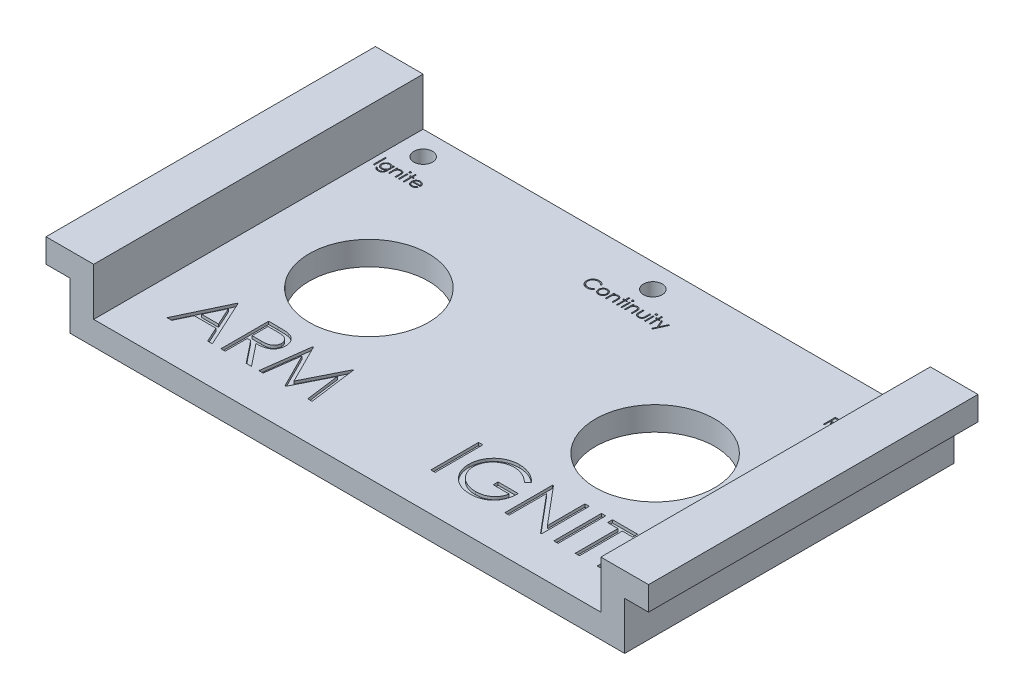
from build123d import *

# Parameters (mm, degrees)
IZIM1_W                     = 147.7
IZIM1_H                     = 87.7
Y_KSEKLIK_EKSTR_ZYON1_DEPTH = 6.35
IZIM2_W                     = 87.700000114
IZIM2_H                     = 12.7
Y_KSEKLIK_EKSTR_ZYON2_DEPTH = 6.35
IZIM3_W                     = 87.7
IZIM3_H                     = 12.7
Y_KSEKLIK_EKSTR_ZYON3_DEPTH = 6.35
IZIM6_W                     = 87.7
IZIM6_H                     = 6.35
Y_KSEKLIK_EKSTR_ZYON4_DEPTH = 6.35
IZIM4_W                     = 87.7
IZIM4_H                     = 6.35
Y_KSEKLIK_EKSTR_ZYON5_DEPTH = 6.35
IZIM7_R                     = 15.875
KES_EKSTR_ZYON1_DEPTH       = 6.35
IZIM8_R                     = 15.875
KES_EKSTR_ZYON2_DEPTH       = 6.35
IZIM9_R                     = 2.5
KES_EKSTR_ZYON3_DEPTH       = 6.35
IZIM10_R                    = 2.5
KES_EKSTR_ZYON4_DEPTH       = 6.35
IZIM11_W                    = 0.284935897
IZIM11_H                    = 2.320192308
KES_EKSTR_ZYON5_DEPTH       = 0.762
IZIM12_W                    = 0.284935897
IZIM12_H                    = 2.320192308
KES_EKSTR_ZYON6_DEPTH       = 0.762
KES_EKSTR_ZYON7_DEPTH       = 0.762
IZIM14_W                    = 1.139743589
IZIM14_H                    = 12.7
KES_EKSTR_ZYON8_DEPTH       = 0.762
IZIM15_R                    = 2.5
KES_EKSTR_ZYON9_DEPTH       = 6.35
IZIM16_W                    = 0.284935898
IZIM16_H                    = 3.175
IZIM16_W_2                  = 0.284935897
IZIM16_H_2                  = 2.320192308
KES_EKSTR_ZYON10_DEPTH      = 0.762


with BuildPart() as part:
    # Çizim1 → Yükseklik-Ekstrüzyon1 (new body)
    with BuildSketch(Plane(origin=(0, 0, 0), x_dir=(1, 0, 0), z_dir=(0, 1, 0))):
        Rectangle(IZIM1_W, IZIM1_H)
    extrude(amount=Y_KSEKLIK_EKSTR_ZYON1_DEPTH)

    # Çizim2 → Yükseklik-Ekstrüzyon2 (add)
    with BuildSketch(Plane.ZY.offset(73.85)):
        with Locations((5.7e-08, 12.7)):
            Rectangle(IZIM2_W, IZIM2_H)
    extrude(amount=-Y_KSEKLIK_EKSTR_ZYON2_DEPTH)

    # Çizim3 → Yükseklik-Ekstrüzyon3 (add)
    with BuildSketch(Plane(origin=(73.85, 0, 0), x_dir=(0, 0, -1), z_dir=(1, 0, 0))):
        with Locations((0, 12.7)):
            Rectangle(IZIM3_W, IZIM3_H)
    extrude(amount=-Y_KSEKLIK_EKSTR_ZYON3_DEPTH)

    # Çizim6 → Yükseklik-Ekstrüzyon4 (add)
    with BuildSketch(Plane.ZY.offset(73.85)):
        with Locations((0, 15.875)):
            Rectangle(IZIM6_W, IZIM6_H)
    extrude(amount=Y_KSEKLIK_EKSTR_ZYON4_DEPTH)

    # Çizim4 → Yükseklik-Ekstrüzyon5 (add)
    with BuildSketch(Plane(origin=(73.85, 0, 0), x_dir=(0, 0, -1), z_dir=(1, 0, 0))):
        with Locations((0, 15.875)):
            Rectangle(IZIM4_W, IZIM4_H)
    extrude(amount=Y_KSEKLIK_EKSTR_ZYON5_DEPTH)

    # Çizim7 → Kes-Ekstrüzyon1 (cut)
    with BuildSketch(Plane(origin=(0, 6.35, 0), x_dir=(1, 0, 0), z_dir=(0, 1, 0))):
        with Locations((-38.1, 0)):
            Circle(IZIM7_R)
    extrude(amount=-KES_EKSTR_ZYON1_DEPTH, mode=Mode.SUBTRACT)

    # Çizim8 → Kes-Ekstrüzyon2 (cut)
    with BuildSketch(Plane(origin=(0, 6.35, 0), x_dir=(1, 0, 0), z_dir=(0, 1, 0))):
        with Locations((38.1, 0)):
            Circle(IZIM8_R)
    extrude(amount=-KES_EKSTR_ZYON2_DEPTH, mode=Mode.SUBTRACT)

    # Çizim9 → Kes-Ekstrüzyon3 (cut)
    with BuildSketch(Plane(origin=(0, 6.35, 0), x_dir=(1, 0, 0), z_dir=(0, 1, 0))):
        with Locations((61.15, 37.5)):
            Circle(IZIM9_R)
    extrude(amount=-KES_EKSTR_ZYON3_DEPTH, mode=Mode.SUBTRACT)

    # Çizim10 → Kes-Ekstrüzyon4 (cut)
    with BuildSketch(Plane(origin=(0, 6.35, 0), x_dir=(1, 0, 0), z_dir=(0, 1, 0))):
        with Locations((0, 37.5)):
            Circle(IZIM10_R)
    extrude(amount=-KES_EKSTR_ZYON4_DEPTH, mode=Mode.SUBTRACT)

    # Çizim11 → Kes-Ekstrüzyon5 (cut)
    # profile 1 of 12: a face of its own
    with BuildSketch(Plane(origin=(0, 6.35, 0), x_dir=(1, 0, 0), z_dir=(0, 1, 0))):
        with BuildLine():
            Line((-7.736114872, 31.710407853), (-7.985433783, 31.519602564))
            add(Edge.make_bspline(
                [(-7.985433783, 31.519602564), (-8.003219124, 31.540798837), (-8.038550022, 31.58290561), (-8.09539087, 31.642032768), (-8.154628789, 31.697427684), (-8.216241135, 31.749354246), (-8.281336908, 31.795996598), (-8.348339203, 31.839785384), (-8.418368859, 31.879035404), (-8.515207932, 31.926626827), (-8.64188848, 31.97628941), (-8.801359513, 32.017930199), (-8.967830295, 32.04443798), (-9.081402403, 32.047308943), (-9.13916976, 32.048769231)],
                knots=[0, 0, 0, 0, 0.757959112, 1.505699292, 2.245454638, 2.979532153, 3.711538275, 4.438200793, 5.171680507, 5.909471876, 7.393775596, 8.890124382, 10.418191784, 12, 12, 12, 12], degree=3))
            add(Edge.make_bspline(
                [(-9.13916976, 32.048769231), (-9.170995324, 32.048402779), (-9.234351082, 32.047673277), (-9.328375054, 32.038049285), (-9.420643322, 32.024522687), (-9.511095867, 32.004451858), (-9.59961755, 31.979076696), (-9.686787087, 31.948755071), (-9.771342416, 31.911240323), (-9.854453247, 31.869776402), (-9.934081531, 31.822942934), (-10.009424324, 31.771858679), (-10.080206838, 31.717095284), (-10.146485065, 31.658447495), (-10.208326761, 31.596179431), (-10.265283821, 31.529627492), (-10.317159158, 31.459004449), (-10.364981031, 31.385241573), (-10.407809724, 31.308553719), (-10.443668972, 31.228657048), (-10.475423619, 31.146919754), (-10.500550789, 31.062418344), (-10.520439458, 30.975747406), (-10.534162409, 30.886674334), (-10.543676951, 30.795385211), (-10.544402826, 30.73350962), (-10.544768718, 30.702319912)],
                knots=[0, 0, 0, 0, 1.054917814, 2.100044995, 3.131103042, 4.146048494, 5.169673617, 6.183595914, 7.203665975, 8.234915748, 9.262203917, 10.264457458, 11.251630812, 12.227803204, 13.197192746, 14.159520551, 15.12972552, 16.100847026, 17.073214652, 18.039054194, 19.002613845, 19.979014051, 20.95965708, 21.949030935, 22.966165397, 24, 24, 24, 24], degree=3))
            add(Edge.make_bspline(
                [(-10.544768718, 30.702319912), (-10.543624068, 30.655392215), (-10.5413767, 30.563255905), (-10.521375711, 30.428299709), (-10.490981807, 30.299013097), (-10.445429105, 30.176204241), (-10.38925968, 30.058358801), (-10.318284268, 29.947470699), (-10.236082124, 29.841864244), (-10.141490329, 29.744035284), (-10.03770791, 29.654669262), (-9.926358019, 29.575974091), (-9.807717986, 29.510374162), (-9.683097758, 29.455785982), (-9.551538354, 29.413824522), (-9.413276355, 29.38428421), (-9.268612474, 29.365014518), (-9.169761661, 29.363169672), (-9.119453214, 29.362230769)],
                knots=[0, 0, 0, 0, 1.029171465, 2.020641659, 2.987623507, 3.938342917, 4.889210282, 5.84687017, 6.821220943, 7.821438502, 8.827599549, 9.822697543, 10.807740252, 11.797342354, 12.80366471, 13.83203677, 14.896651826, 16, 16, 16, 16], degree=3))
            add(Edge.make_bspline(
                [(-9.119453214, 29.362230769), (-9.064024346, 29.363762734), (-8.954927074, 29.366778006), (-8.794936079, 29.392322468), (-8.64177792, 29.433740722), (-8.495444359, 29.491705266), (-8.35634793, 29.567057348), (-8.22427096, 29.658404709), (-8.099101964, 29.766616268), (-8.023835158, 29.849241677), (-7.985433783, 29.891397436)],
                knots=[0, 0, 0, 0, 1.028121516, 2.023589091, 2.998037872, 3.967518031, 4.937445131, 5.927275754, 6.942489185, 8, 8, 8, 8], degree=3))
            Line((-7.985433783, 29.891397436), (-7.736114872, 29.7025002))
            add(Edge.make_bspline(
                [(-7.736114872, 29.7025002), (-7.756179158, 29.676611748), (-7.796211622, 29.624958846), (-7.861034251, 29.552140938), (-7.929321514, 29.483647992), (-8.001580622, 29.420032221), (-8.076980333, 29.36002067), (-8.156874502, 29.305318294), (-8.240212839, 29.255161564), (-8.326712973, 29.209235711), (-8.416283001, 29.168489351), (-8.508815595, 29.13360629), (-8.603911903, 29.103557283), (-8.701576271, 29.078835883), (-8.802011279, 29.059539972), (-8.904854495, 29.046640695), (-9.010327882, 29.037803387), (-9.081485457, 29.036997921), (-9.117545161, 29.036589744)],
                knots=[0, 0, 0, 0, 0.986787822, 1.968848986, 2.935600012, 3.899624008, 4.868462664, 5.837806735, 6.815139263, 7.798259679, 8.787526145, 9.778297419, 10.776456485, 11.791383307, 12.812564526, 13.85620153, 14.913611965, 16, 16, 16, 16], degree=3))
            add(Edge.make_bspline(
                [(-9.117545161, 29.036589744), (-9.151693344, 29.036827408), (-9.219217149, 29.037297361), (-9.318911017, 29.044910255), (-9.415965851, 29.055296803), (-9.510104261, 29.070936064), (-9.601839967, 29.089391287), (-9.690341354, 29.114130213), (-9.776479295, 29.141842671), (-9.859907719, 29.174413623), (-9.940697589, 29.211167589), (-10.018588332, 29.252707074), (-10.093544125, 29.298682766), (-10.166301899, 29.34808124), (-10.23578685, 29.402489221), (-10.30260112, 29.461151096), (-10.367119366, 29.523869149), (-10.407036087, 29.569094623), (-10.427105457, 29.591833133)],
                knots=[0, 0, 0, 0, 1.114604814, 2.203992996, 3.262667896, 4.300477797, 5.318619304, 6.316056647, 7.298880507, 8.271930387, 9.238335007, 10.195173496, 11.151986948, 12.108099108, 13.064862484, 14.031167946, 15.010108607, 16, 16, 16, 16], degree=3))
            add(Edge.make_bspline(
                [(-10.427105457, 29.591833133), (-10.459250648, 29.631331212), (-10.523152945, 29.709850513), (-10.604909815, 29.837109939), (-10.674893669, 29.969977528), (-10.73147754, 30.109151321), (-10.775712305, 30.254319022), (-10.806356675, 30.40555381), (-10.826269916, 30.562714444), (-10.828547106, 30.669609245), (-10.829704616, 30.723944511)],
                knots=[0, 0, 0, 0, 0.994628077, 1.977248131, 2.950237994, 3.925870899, 4.908910175, 5.911660606, 6.938484602, 8, 8, 8, 8], degree=3))
            add(Edge.make_bspline(
                [(-10.829704616, 30.723944511), (-10.828293833, 30.781054101), (-10.825518206, 30.893413654), (-10.801936306, 31.058308598), (-10.764000684, 31.216288795), (-10.710119221, 31.367059335), (-10.641806509, 31.511413232), (-10.557418081, 31.648247753), (-10.457934316, 31.778437993), (-10.344135451, 31.900008518), (-10.219342225, 32.011169216), (-10.085703016, 32.108964844), (-9.943479392, 32.190351447), (-9.794238198, 32.25838368), (-9.636861901, 32.310675443), (-9.471686274, 32.347281549), (-9.299021687, 32.370066361), (-9.181217915, 32.372946728), (-9.121361266, 32.374410256)],
                knots=[0, 0, 0, 0, 1.032925535, 2.032216505, 3.007276963, 3.968222605, 4.92396291, 5.891752235, 6.871517503, 7.883894988, 8.900124299, 9.891468569, 10.874487609, 11.85992873, 12.854644235, 13.869047385, 14.917252991, 16, 16, 16, 16], degree=3))
            add(Edge.make_bspline(
                [(-9.121361266, 32.374410256), (-9.084880996, 32.373972888), (-9.012671973, 32.373107162), (-8.905853495, 32.364665162), (-8.801856527, 32.350592104), (-8.700609422, 32.331436813), (-8.60161962, 32.307663028), (-8.505643688, 32.2766929), (-8.41211845, 32.24128119), (-8.321633755, 32.200497439), (-8.234623742, 32.154716895), (-8.15111551, 32.104447007), (-8.071772388, 32.049750098), (-7.996036076, 31.99109136), (-7.925173513, 31.92722981), (-7.857172743, 31.859921991), (-7.79434305, 31.787229165), (-7.755559795, 31.736061832), (-7.736114872, 31.710407853)],
                knots=[0, 0, 0, 0, 1.096760587, 2.17092713, 3.219439832, 4.250915756, 5.268269357, 6.278326846, 7.281116186, 8.274029601, 9.260640565, 10.235837813, 11.203064059, 12.156899882, 13.114053108, 14.069676657, 15.032185724, 16, 16, 16, 16], degree=3))
        make_face()
    # profile 2 of 12: a face of its own
    with BuildSketch(Plane(origin=(0, 6.35, 0), x_dir=(1, 0, 0), z_dir=(0, 1, 0))):
        with BuildLine():
            add(Edge.make_bspline(
                [(-6.045580016, 31.478897436), (-6.002045076, 31.477970435), (-5.916683697, 31.476152812), (-5.791672258, 31.456726379), (-5.672342028, 31.427019841), (-5.558235982, 31.385952067), (-5.450815485, 31.330904869), (-5.348515857, 31.265219298), (-5.25161757, 31.187402231), (-5.193539536, 31.127205983), (-5.164059584, 31.096650841)],
                knots=[0, 0, 0, 0, 1.054011418, 2.066658804, 3.057071809, 4.030435133, 4.997543892, 5.974964718, 6.972108034, 8, 8, 8, 8], degree=3))
            add(Edge.make_bspline(
                [(-5.164059584, 31.096650841), (-5.138675954, 31.067428154), (-5.088399938, 31.00954832), (-5.023933178, 30.915699299), (-4.968396477, 30.818507922), (-4.923889363, 30.716683562), (-4.88879652, 30.61111511), (-4.86388121, 30.501439714), (-4.849061276, 30.387899585), (-4.84706287, 30.31078896), (-4.84605077, 30.271735978)],
                knots=[0, 0, 0, 0, 1.025258237, 2.030674902, 3.01204498, 3.988269485, 4.97094183, 5.956517959, 6.965070386, 8, 8, 8, 8], degree=3))
            add(Edge.make_bspline(
                [(-4.84605077, 30.271735978), (-4.846940983, 30.23245664), (-4.848700086, 30.154838836), (-4.865340366, 30.040521268), (-4.891222137, 29.929673108), (-4.928262447, 29.822758435), (-4.975758732, 29.719450442), (-5.033716713, 29.620200351), (-5.102543108, 29.524812344), (-5.18056102, 29.434096391), (-5.26678665, 29.350488468), (-5.360327728, 29.277619252), (-5.45934603, 29.215188297), (-5.565158214, 29.164899549), (-5.676798006, 29.125248606), (-5.794506204, 29.097399306), (-5.918099946, 29.080561207), (-6.002488925, 29.078398966), (-6.045580016, 29.077294872)],
                knots=[0, 0, 0, 0, 0.998656419, 1.973391657, 2.932242238, 3.890759089, 4.846373663, 5.82037756, 6.809684879, 7.83454468, 8.860553229, 9.859544525, 10.845671541, 11.83227036, 12.833544569, 13.85385346, 14.904124723, 16, 16, 16, 16], degree=3))
            add(Edge.make_bspline(
                [(-6.045580016, 29.077294872), (-6.088882226, 29.078402671), (-6.173691792, 29.080572352), (-6.29772179, 29.097333887), (-6.415640944, 29.125235772), (-6.527426887, 29.165029854), (-6.633693998, 29.215189905), (-6.733286035, 29.277430509), (-6.826903101, 29.350510078), (-6.913146973, 29.434090535), (-6.991159993, 29.524813853), (-7.059987651, 29.620199959), (-7.117945304, 29.719450544), (-7.165441674, 29.822758408), (-7.202481962, 29.929673115), (-7.228363739, 30.040521266), (-7.245004018, 30.154838836), (-7.246763121, 30.23245664), (-7.247653334, 30.271735978)],
                knots=[0, 0, 0, 0, 1.099876186, 2.154163076, 3.173186993, 4.173200201, 5.163417411, 6.152872554, 7.150605724, 8.17532212, 9.198891216, 10.186952605, 11.159729845, 12.11414092, 13.071450619, 14.029093627, 15.002601286, 16, 16, 16, 16], degree=3))
            add(Edge.make_bspline(
                [(-7.247653334, 30.271735978), (-7.246634331, 30.310576701), (-7.24461688, 30.387474659), (-7.229811847, 30.50080135), (-7.204993728, 30.610291124), (-7.169858818, 30.715452092), (-7.124941466, 30.816830237), (-7.070185155, 30.914261763), (-7.005060796, 31.00768641), (-6.95498474, 31.06549144), (-6.92964452, 31.094742788)],
                knots=[0, 0, 0, 0, 1.031353054, 2.041901799, 3.029428768, 4.008703097, 4.981709435, 5.96992636, 6.972712378, 8, 8, 8, 8], degree=3))
            add(Edge.make_bspline(
                [(-6.92964452, 31.094742788), (-6.900209012, 31.125562912), (-6.842318907, 31.186176108), (-6.744938275, 31.263766326), (-6.642890309, 31.330818764), (-6.534282698, 31.384772189), (-6.420270391, 31.427261415), (-6.300328649, 31.45680299), (-6.174893003, 31.476082819), (-6.089113918, 31.47794988), (-6.045580016, 31.478897436)],
                knots=[0, 0, 0, 0, 1.027980169, 2.021703884, 2.998553061, 3.971491411, 4.943284454, 5.930300938, 6.949603206, 8, 8, 8, 8], degree=3))
        make_face()
        with BuildLine():
            add(Edge.make_bspline(
                [(-6.046852052, 31.193961538), (-6.077638313, 31.193086516), (-6.138416094, 31.19135906), (-6.227878146, 31.178220089), (-6.314002429, 31.157403425), (-6.396952337, 31.127826888), (-6.476448144, 31.089637172), (-6.552565959, 31.042730303), (-6.625529672, 30.987727549), (-6.693911973, 30.924714983), (-6.756670213, 30.855881895), (-6.811532377, 30.782540884), (-6.858182295, 30.705881555), (-6.897044439, 30.625824192), (-6.925988817, 30.541557503), (-6.947010059, 30.454035787), (-6.960136634, 30.363080731), (-6.961847849, 30.30124895), (-6.962717436, 30.269827925)],
                knots=[0, 0, 0, 0, 1.021534396, 2.016698045, 2.994645724, 3.958388632, 4.93408049, 5.916473867, 6.921342795, 7.962252576, 8.998418191, 10.008913653, 10.997312074, 11.973003931, 12.956656626, 13.948281152, 14.957379055, 16, 16, 16, 16], degree=3))
            add(Edge.make_bspline(
                [(-6.962717436, 30.269827925), (-6.961259818, 30.229231443), (-6.958366717, 30.148655018), (-6.934839753, 30.029990642), (-6.895482199, 29.916069962), (-6.842335167, 29.807560812), (-6.77574524, 29.707165246), (-6.697289115, 29.617656113), (-6.607808815, 29.540380413), (-6.50837099, 29.476262789), (-6.401006716, 29.425317867), (-6.287381339, 29.389214511), (-6.168871567, 29.36574519), (-6.087881189, 29.363412495), (-6.046852052, 29.362230769)],
                knots=[0, 0, 0, 0, 1.016792936, 2.018143844, 3.017858371, 4.030088057, 5.03801393, 6.028138512, 7.003788237, 7.991172063, 8.984598303, 9.972568034, 10.972917682, 12, 12, 12, 12], degree=3))
            add(Edge.make_bspline(
                [(-6.046852052, 29.362230769), (-6.005825274, 29.363419381), (-5.924839555, 29.365765666), (-5.806494445, 29.38909631), (-5.693179627, 29.425476059), (-5.585926869, 29.476205493), (-5.486534307, 29.540623898), (-5.396410461, 29.617219754), (-5.318624221, 29.707402319), (-5.252100165, 29.807693792), (-5.198082763, 29.91590174), (-5.15890943, 30.030011668), (-5.135325905, 30.148649663), (-5.132440439, 30.229229649), (-5.130986667, 30.269827925)],
                knots=[0, 0, 0, 0, 1.02726834, 2.027799167, 3.010890988, 4.004497153, 4.992059811, 5.971914811, 6.958719428, 7.966827853, 8.981595046, 9.981490638, 10.983022906, 12, 12, 12, 12], degree=3))
            add(Edge.make_bspline(
                [(-5.130986667, 30.269827925), (-5.131855955, 30.301249138), (-5.133566581, 30.363081288), (-5.146697441, 30.454033657), (-5.167702824, 30.541565319), (-5.196705648, 30.625795351), (-5.235398932, 30.706088837), (-5.282948451, 30.782315804), (-5.337586596, 30.856135956), (-5.401102127, 30.924492473), (-5.469413048, 30.987752114), (-5.542406333, 31.042751631), (-5.618411278, 31.089431021), (-5.697676135, 31.12815354), (-5.780636678, 31.157134341), (-5.866640288, 31.178340285), (-5.955720637, 31.191303535), (-6.016280627, 31.193069871), (-6.046852052, 31.193961538)],
                knots=[0, 0, 0, 0, 1.042956736, 2.052379634, 3.044323526, 4.02829302, 5.004299113, 5.996692471, 7.007513377, 8.048758398, 9.090003419, 10.095195979, 11.07790575, 12.047570684, 13.018257071, 13.989683339, 14.985167495, 16, 16, 16, 16], degree=3))
        make_face(mode=Mode.SUBTRACT)
    # profile 3 of 12: a face of its own
    with BuildSketch(Plane(origin=(0, 6.35, 0), x_dir=(1, 0, 0), z_dir=(0, 1, 0))):
        with BuildLine():
            Line((-4.276178975, 31.438192308), (-3.991243077, 31.438192308))
            Line((-3.991243077, 31.438192308), (-3.991243077, 31.019692708))
            add(Edge.make_bspline(
                [(-3.991243077, 31.019692708), (-3.960819651, 31.057650035), (-3.901781931, 31.131307553), (-3.803461858, 31.22811836), (-3.699554177, 31.307897243), (-3.590695216, 31.371491399), (-3.4767372, 31.419430838), (-3.358374769, 31.45405279), (-3.234899286, 31.474812599), (-3.150930118, 31.477525165), (-3.108450609, 31.478897436)],
                knots=[0, 0, 0, 0, 1.12780773, 2.188550248, 3.19190651, 4.159438251, 5.104880172, 6.052711206, 7.014878035, 8, 8, 8, 8], degree=3))
            add(Edge.make_bspline(
                [(-3.108450609, 31.478897436), (-3.065514963, 31.477314294), (-2.981479546, 31.474215704), (-2.859125876, 31.449707706), (-2.744850011, 31.407847367), (-2.639059414, 31.350504989), (-2.543694014, 31.279197688), (-2.459942184, 31.196123558), (-2.39066981, 31.100568682), (-2.344226488, 31.011919819), (-2.313632507, 30.933280699), (-2.294371744, 30.86592829), (-2.278015068, 30.79089111), (-2.263834839, 30.708395911), (-2.254239888, 30.617864696), (-2.246672238, 30.519668575), (-2.241248708, 30.413839357), (-2.241033527, 30.340645059), (-2.240922565, 30.302900841)],
                knots=[0, 0, 0, 0, 1.235846778, 2.418850247, 3.575807741, 4.728682307, 5.871620074, 6.994088408, 8.11269785, 9.256955736, 9.865816715, 10.540099792, 11.271859618, 12.076849838, 12.949306005, 13.892391288, 14.913166135, 16, 16, 16, 16], degree=3))
            Line((-2.240922565, 30.302900841), (-2.240922565, 29.118))
            Line((-2.240922565, 29.118), (-2.525858462, 29.118))
            Line((-2.525858462, 29.118), (-2.525858462, 30.20940625))
            add(Edge.make_bspline(
                [(-2.525858462, 30.20940625), (-2.526033729, 30.240995182), (-2.526368986, 30.301419433), (-2.527426394, 30.387932762), (-2.52997529, 30.466388443), (-2.533556974, 30.536598912), (-2.53879938, 30.59849675), (-2.544262767, 30.652208022), (-2.550943853, 30.697664536), (-2.556897353, 30.725028575), (-2.559567396, 30.737300881)],
                knots=[0, 0, 0, 0, 1.430800155, 2.736877192, 3.918605307, 4.986035426, 5.920637409, 6.731861385, 7.431261377, 8, 8, 8, 8], degree=3))
            add(Edge.make_bspline(
                [(-2.559567396, 30.737300881), (-2.569206271, 30.773324599), (-2.587758123, 30.84265911), (-2.633599665, 30.936706559), (-2.691488244, 31.016714915), (-2.762152721, 31.082189512), (-2.844910526, 31.133144486), (-2.939532005, 31.16849943), (-3.045104058, 31.190612189), (-3.119357676, 31.192813944), (-3.158059984, 31.193961538)],
                knots=[0, 0, 0, 0, 1.084156227, 2.086665306, 3.027808233, 3.945421172, 4.874247719, 5.839848303, 6.874090471, 8, 8, 8, 8], degree=3))
            add(Edge.make_bspline(
                [(-3.158059984, 31.193961538), (-3.180981383, 31.193529734), (-3.226342239, 31.192675205), (-3.293606856, 31.184101527), (-3.358852356, 31.1700785), (-3.422733546, 31.151147664), (-3.483972759, 31.125146892), (-3.544537509, 31.095638106), (-3.602147216, 31.058855085), (-3.658030298, 31.017860735), (-3.710021202, 30.97243174), (-3.758397623, 30.92449422), (-3.801521399, 30.873444208), (-3.84059084, 30.820104256), (-3.874316836, 30.763741803), (-3.903756423, 30.704900611), (-3.928735232, 30.643503233), (-3.941147388, 30.600890141), (-3.947357861, 30.57956851)],
                knots=[0, 0, 0, 0, 1.023777757, 2.026029729, 3.023749952, 4.003683103, 4.997618607, 5.993177895, 7.010360494, 8.046726602, 9.087585522, 10.09234134, 11.086953743, 12.070360549, 13.043493632, 14.017870808, 15.008233677, 16, 16, 16, 16], degree=3))
            add(Edge.make_bspline(
                [(-3.947357861, 30.57956851), (-3.950931685, 30.563915575), (-3.958711713, 30.529839956), (-3.967114741, 30.473919662), (-3.974741613, 30.409231327), (-3.981125139, 30.33585044), (-3.985030767, 30.253520082), (-3.989289256, 30.162591857), (-3.990839618, 30.062703193), (-3.991104825, 29.993160086), (-3.991243077, 29.956907252)],
                knots=[0, 0, 0, 0, 0.615963638, 1.340920617, 2.168419149, 3.115676021, 4.16674242, 5.331190069, 6.6087489, 8, 8, 8, 8], degree=3))
            Line((-3.991243077, 29.956907252), (-3.991243077, 29.118))
            Line((-3.991243077, 29.118), (-4.276178975, 29.118))
            Line((-4.276178975, 29.118), (-4.276178975, 31.438192308))
        make_face()
    # profile 4 of 12: a face of its own
    with BuildSketch(Plane(origin=(0, 6.35, 0), x_dir=(1, 0, 0), z_dir=(0, 1, 0))):
        Polygon((-1.304704616, 32.374410256), (-1.019768718, 32.374410256), (-1.019768718, 31.438192308), (-0.612717436, 31.438192308), (-0.612717436, 31.15325641), (-1.019768718, 31.15325641), (-1.019768718, 29.118), (-1.304704616, 29.118), (-1.304704616, 31.15325641), (-1.711755898, 31.15325641), (-1.711755898, 31.438192308), (-1.304704616, 31.438192308), align=None)
    # profile 5 of 12: a face of its own
    with BuildSketch(Plane(origin=(0, 6.35, 0), x_dir=(1, 0, 0), z_dir=(0, 1, 0))):
        with BuildLine():
            add(Edge.make_bspline(
                [(-0.023765113, 32.415115385), (-0.006083705, 32.414295189), (0.028539888, 32.412689089), (0.078608066, 32.398935463), (0.124198356, 32.375622177), (0.164636728, 32.344344181), (0.199336654, 32.307560043), (0.223630584, 32.264687593), (0.239244686, 32.218370114), (0.241130233, 32.18606214), (0.242090256, 32.16961258)],
                knots=[0, 0, 0, 0, 1.055194115, 2.066272739, 3.074728998, 4.095836921, 5.109056067, 6.073838105, 7.019297344, 8, 8, 8, 8], degree=3))
            add(Edge.make_bspline(
                [(0.242090256, 32.16961258), (0.241108582, 32.15359003), (0.23916793, 32.121915346), (0.223642644, 32.076400839), (0.199129614, 32.034124096), (0.164658979, 31.997411381), (0.12419246, 31.966150675), (0.078609633, 31.942832805), (0.028539476, 31.929080395), (-0.006083844, 31.927474127), (-0.023765113, 31.926653846)],
                knots=[0, 0, 0, 0, 0.96129708, 1.900370562, 2.859976407, 3.87933698, 4.906634145, 5.921202961, 6.938410037, 8, 8, 8, 8], degree=3))
            add(Edge.make_bspline(
                [(-0.023765113, 31.926653846), (-0.041244191, 31.927442807), (-0.075264933, 31.928978415), (-0.124583426, 31.943102646), (-0.169784984, 31.966158655), (-0.210302223, 31.997206694), (-0.244075326, 32.034349565), (-0.268657379, 32.076375039), (-0.284146808, 32.121921915), (-0.286092293, 32.153592237), (-0.287076411, 32.16961258)],
                knots=[0, 0, 0, 0, 1.054934014, 2.053291228, 3.073705704, 4.106921865, 5.123545215, 6.088680038, 7.033164197, 8, 8, 8, 8], degree=3))
            add(Edge.make_bspline(
                [(-0.287076411, 32.16961258), (-0.286113854, 32.186059851), (-0.284223331, 32.218363328), (-0.268645768, 32.264713822), (-0.244280085, 32.307332756), (-0.21027986, 32.344548745), (-0.169790935, 32.375614247), (-0.124581888, 32.398665637), (-0.075265339, 32.412791066), (-0.041244329, 32.414326509), (-0.023765113, 32.415115385)],
                knots=[0, 0, 0, 0, 0.98631895, 1.937192651, 2.907499808, 3.917963147, 4.944918757, 5.95915025, 6.951458133, 8, 8, 8, 8], degree=3))
        make_face()
    # profile 6 of 12: a face of its own
    with BuildSketch(Plane(origin=(0, 6.35, 0), x_dir=(1, 0, 0), z_dir=(0, 1, 0))):
        with Locations((-0.022493077, 30.278096154)):
            Rectangle(IZIM11_W, IZIM11_H)
    # profile 7 of 12: a face of its own
    with BuildSketch(Plane(origin=(0, 6.35, 0), x_dir=(1, 0, 0), z_dir=(0, 1, 0))):
        with BuildLine():
            Line((0.811962051, 31.438192308), (1.096897948, 31.438192308))
            Line((1.096897948, 31.438192308), (1.096897948, 31.019692708))
            add(Edge.make_bspline(
                [(1.096897948, 31.019692708), (1.127321374, 31.057650035), (1.186359094, 31.131307553), (1.284679168, 31.22811836), (1.388586849, 31.307897243), (1.497445809, 31.371491399), (1.611403826, 31.419430838), (1.729766256, 31.45405279), (1.85324174, 31.474812599), (1.937210907, 31.477525165), (1.979690416, 31.478897436)],
                knots=[0, 0, 0, 0, 1.12780773, 2.188550248, 3.19190651, 4.159438251, 5.104880172, 6.052711206, 7.014878035, 8, 8, 8, 8], degree=3))
            add(Edge.make_bspline(
                [(1.979690416, 31.478897436), (2.022626063, 31.477314294), (2.10666148, 31.474215704), (2.22901515, 31.449707706), (2.343291014, 31.407847367), (2.449081611, 31.350504989), (2.544447012, 31.279197688), (2.628198842, 31.196123558), (2.697471216, 31.100568682), (2.743914538, 31.011919819), (2.774508519, 30.933280699), (2.793769282, 30.86592829), (2.810125958, 30.79089111), (2.824306186, 30.708395911), (2.833901138, 30.617864696), (2.841468788, 30.519668575), (2.846892318, 30.413839357), (2.847107499, 30.340645059), (2.847218461, 30.302900841)],
                knots=[0, 0, 0, 0, 1.235846778, 2.418850247, 3.575807741, 4.728682307, 5.871620074, 6.994088408, 8.11269785, 9.256955736, 9.865816715, 10.540099792, 11.271859618, 12.076849838, 12.949306005, 13.892391288, 14.913166135, 16, 16, 16, 16], degree=3))
            Line((2.847218461, 30.302900841), (2.847218461, 29.118))
            Line((2.847218461, 29.118), (2.562282564, 29.118))
            Line((2.562282564, 29.118), (2.562282564, 30.20940625))
            add(Edge.make_bspline(
                [(2.562282564, 30.20940625), (2.562107296, 30.240995182), (2.56177204, 30.301419433), (2.560714632, 30.387932762), (2.558165736, 30.466388443), (2.554584052, 30.536598912), (2.549341646, 30.59849675), (2.543878259, 30.652208022), (2.537197173, 30.697664536), (2.531243673, 30.725028575), (2.528573629, 30.737300881)],
                knots=[0, 0, 0, 0, 1.430800155, 2.736877192, 3.918605307, 4.986035426, 5.920637409, 6.731861385, 7.431261377, 8, 8, 8, 8], degree=3))
            add(Edge.make_bspline(
                [(2.528573629, 30.737300881), (2.518934754, 30.773324599), (2.500382902, 30.84265911), (2.45454136, 30.936706559), (2.396652782, 31.016714915), (2.325988304, 31.082189512), (2.2432305, 31.133144486), (2.148609021, 31.16849943), (2.043036968, 31.190612189), (1.968783349, 31.192813944), (1.930081041, 31.193961538)],
                knots=[0, 0, 0, 0, 1.084156227, 2.086665306, 3.027808233, 3.945421172, 4.874247719, 5.839848303, 6.874090471, 8, 8, 8, 8], degree=3))
            add(Edge.make_bspline(
                [(1.930081041, 31.193961538), (1.907159643, 31.193529734), (1.861798787, 31.192675205), (1.794534169, 31.184101527), (1.729288669, 31.1700785), (1.66540748, 31.151147664), (1.604168267, 31.125146892), (1.543603517, 31.095638106), (1.48599381, 31.058855085), (1.430110728, 31.017860735), (1.378119824, 30.97243174), (1.329743403, 30.92449422), (1.286619627, 30.873444208), (1.247550186, 30.820104256), (1.21382419, 30.763741803), (1.184384603, 30.704900611), (1.159405794, 30.643503233), (1.146993637, 30.600890141), (1.140783165, 30.57956851)],
                knots=[0, 0, 0, 0, 1.023777757, 2.026029729, 3.023749952, 4.003683103, 4.997618607, 5.993177895, 7.010360494, 8.046726602, 9.087585522, 10.09234134, 11.086953743, 12.070360549, 13.043493632, 14.017870808, 15.008233677, 16, 16, 16, 16], degree=3))
            add(Edge.make_bspline(
                [(1.140783165, 30.57956851), (1.137209341, 30.563915575), (1.129429312, 30.529839956), (1.121026285, 30.473919662), (1.113399413, 30.409231327), (1.107015886, 30.33585044), (1.103110259, 30.253520082), (1.09885177, 30.162591857), (1.097301407, 30.062703193), (1.097036201, 29.993160086), (1.096897948, 29.956907252)],
                knots=[0, 0, 0, 0, 0.615963638, 1.340920617, 2.168419149, 3.115676021, 4.16674242, 5.331190069, 6.6087489, 8, 8, 8, 8], degree=3))
            Line((1.096897948, 29.956907252), (1.096897948, 29.118))
            Line((1.096897948, 29.118), (0.811962051, 29.118))
            Line((0.811962051, 29.118), (0.811962051, 31.438192308))
        make_face()
    # profile 8 of 12: a face of its own
    with BuildSketch(Plane(origin=(0, 6.35, 0), x_dir=(1, 0, 0), z_dir=(0, 1, 0))):
        with BuildLine():
            Line((3.457795384, 31.438192308), (3.742731282, 31.438192308))
            Line((3.742731282, 31.438192308), (3.742731282, 30.362050481))
            add(Edge.make_bspline(
                [(3.742731282, 30.362050481), (3.74286001, 30.330461273), (3.74310626, 30.270032597), (3.744776257, 30.183078249), (3.74870427, 30.103778803), (3.753615382, 30.032088448), (3.759931034, 29.968019315), (3.767445226, 29.911795184), (3.775843937, 29.86277846), (3.784065113, 29.833256987), (3.787888533, 29.819527444)],
                knots=[0, 0, 0, 0, 1.388932606, 2.656963016, 3.823490214, 4.879454478, 5.816252168, 6.653371382, 7.373723809, 8, 8, 8, 8], degree=3))
            add(Edge.make_bspline(
                [(3.787888533, 29.819527444), (3.794022139, 29.802270982), (3.806161834, 29.768116817), (3.828181351, 29.718778219), (3.855421342, 29.673080642), (3.8852299, 29.629261947), (3.919610077, 29.588620145), (3.958126883, 29.551223867), (3.999490998, 29.515660155), (4.060954484, 29.473582523), (4.145009675, 29.428483616), (4.255366103, 29.389570981), (4.375022079, 29.36631563), (4.457721503, 29.363617556), (4.500228277, 29.362230769)],
                knots=[0, 0, 0, 0, 0.725840625, 1.436591201, 2.137033971, 2.831655856, 3.53531722, 4.242432219, 4.957935707, 5.694543706, 7.190802206, 8.724350549, 10.316345118, 12, 12, 12, 12], degree=3))
            add(Edge.make_bspline(
                [(4.500228277, 29.362230769), (4.542731102, 29.363647045), (4.624966204, 29.366387276), (4.743307497, 29.388869486), (4.851485566, 29.426430361), (4.948414643, 29.478869942), (5.033655084, 29.543043099), (5.104688378, 29.618343946), (5.163296388, 29.702390176), (5.188886362, 29.765095772), (5.201755721, 29.796630809)],
                knots=[0, 0, 0, 0, 1.157059328, 2.238695713, 3.266970494, 4.264342957, 5.228770407, 6.160125903, 7.074715775, 8, 8, 8, 8], degree=3))
            add(Edge.make_bspline(
                [(5.201755721, 29.796630809), (5.205560487, 29.809300237), (5.213971895, 29.837309249), (5.223009171, 29.884825163), (5.231150289, 29.941489483), (5.238101885, 30.007673001), (5.243059568, 30.083202761), (5.245732035, 30.168055158), (5.248751256, 30.261963821), (5.248797082, 30.327702431), (5.248821025, 30.362050481)],
                knots=[0, 0, 0, 0, 0.557542046, 1.232589297, 2.036731608, 2.971723315, 4.038036528, 5.22795436, 6.551621927, 8, 8, 8, 8], degree=3))
            Line((5.248821025, 30.362050481), (5.248821025, 31.438192308))
            Line((5.248821025, 31.438192308), (5.533756923, 31.438192308))
            Line((5.533756923, 31.438192308), (5.533756923, 30.308625))
            add(Edge.make_bspline(
                [(5.533756923, 30.308625), (5.533356242, 30.270246352), (5.532578868, 30.195786524), (5.52758292, 30.087578794), (5.519010772, 29.986738758), (5.505999908, 29.893213037), (5.490700331, 29.807073036), (5.470964284, 29.728208352), (5.447398311, 29.656861971), (5.420814022, 29.591781931), (5.389407042, 29.532775105), (5.355999674, 29.4767719), (5.317423631, 29.425161881), (5.276810633, 29.375375942), (5.231633416, 29.329890413), (5.182738544, 29.287661575), (5.130814213, 29.248043896), (5.074708155, 29.212582521), (5.015239441, 29.180635993), (4.952334656, 29.15231855), (4.885223322, 29.129909784), (4.814771309, 29.110577966), (4.740633445, 29.095415554), (4.662881202, 29.084723455), (4.581540772, 29.078169047), (4.526105762, 29.077591157), (4.497684206, 29.077294872)],
                knots=[0, 0, 0, 0, 1.493040784, 2.896703357, 4.213163133, 5.428574705, 6.569057535, 7.615249723, 8.588095153, 9.490268104, 10.346124644, 11.18633936, 12.024365274, 12.850166724, 13.684164916, 14.514361689, 15.362232829, 16.222528818, 17.093394965, 17.986930858, 18.902426812, 19.842810585, 20.827885679, 21.843828298, 22.894529745, 24, 24, 24, 24], degree=3))
            add(Edge.make_bspline(
                [(4.497684206, 29.077294872), (4.469475226, 29.077603035), (4.414041953, 29.078208604), (4.332697324, 29.084687243), (4.25472966, 29.095398941), (4.180416155, 29.110689031), (4.109682238, 29.129774473), (4.042241391, 29.152456252), (3.978883302, 29.180650689), (3.91884677, 29.21238033), (3.862601746, 29.248271687), (3.809888965, 29.287612694), (3.760779106, 29.330344623), (3.715261337, 29.376289011), (3.673974565, 29.426015804), (3.636404299, 29.47912499), (3.601972145, 29.535090342), (3.570809257, 29.595019068), (3.544037878, 29.660852249), (3.520402048, 29.733693187), (3.501070255, 29.81434047), (3.485338158, 29.902725148), (3.472682209, 29.998424221), (3.463895494, 30.101991284), (3.458982562, 30.213174061), (3.458199642, 30.289963605), (3.457795384, 30.329613582)],
                knots=[0, 0, 0, 0, 1.083640291, 2.129454052, 3.13281866, 4.105697902, 5.042300162, 5.946461698, 6.836384745, 7.703652036, 8.553297018, 9.397182691, 10.228592656, 11.052265423, 11.879314572, 12.708807002, 13.549817954, 14.402308542, 15.300838682, 16.27712199, 17.341985831, 18.484375296, 19.725102775, 21.0496083, 22.476576903, 24, 24, 24, 24], degree=3))
            Line((3.457795384, 30.329613582), (3.457795384, 31.438192308))
        make_face()
    # profile 9 of 12: a face of its own
    with BuildSketch(Plane(origin=(0, 6.35, 0), x_dir=(1, 0, 0), z_dir=(0, 1, 0))):
        with BuildLine():
            add(Edge.make_bspline(
                [(6.285529759, 32.415115385), (6.303211167, 32.414295189), (6.33783476, 32.412689089), (6.387902938, 32.398935463), (6.433493228, 32.375622177), (6.4739316, 32.344344181), (6.508631525, 32.307560043), (6.532925456, 32.264687593), (6.548539558, 32.218370114), (6.550425104, 32.18606214), (6.551385128, 32.16961258)],
                knots=[0, 0, 0, 0, 1.055194115, 2.066272739, 3.074728998, 4.095836921, 5.109056067, 6.073838105, 7.019297344, 8, 8, 8, 8], degree=3))
            add(Edge.make_bspline(
                [(6.551385128, 32.16961258), (6.550403454, 32.15359003), (6.548462802, 32.121915346), (6.532937516, 32.076400839), (6.508424486, 32.034124096), (6.473953851, 31.997411381), (6.433487332, 31.966150675), (6.387904504, 31.942832805), (6.337834348, 31.929080395), (6.303211028, 31.927474127), (6.285529759, 31.926653846)],
                knots=[0, 0, 0, 0, 0.96129708, 1.900370562, 2.859976407, 3.87933698, 4.906634145, 5.921202961, 6.938410037, 8, 8, 8, 8], degree=3))
            add(Edge.make_bspline(
                [(6.285529759, 31.926653846), (6.268050681, 31.927442807), (6.234029939, 31.928978415), (6.184711446, 31.943102646), (6.139509888, 31.966158655), (6.098992649, 31.997206694), (6.065219545, 32.034349565), (6.040637493, 32.076375039), (6.025148063, 32.121921915), (6.023202579, 32.153592237), (6.022218461, 32.16961258)],
                knots=[0, 0, 0, 0, 1.054934014, 2.053291228, 3.073705704, 4.106921865, 5.123545215, 6.088680038, 7.033164197, 8, 8, 8, 8], degree=3))
            add(Edge.make_bspline(
                [(6.022218461, 32.16961258), (6.023181018, 32.186059851), (6.025071541, 32.218363328), (6.040649104, 32.264713822), (6.065014786, 32.307332756), (6.099015012, 32.344548745), (6.139503937, 32.375614247), (6.184712984, 32.398665637), (6.234029533, 32.412791066), (6.268050543, 32.414326509), (6.285529759, 32.415115385)],
                knots=[0, 0, 0, 0, 0.98631895, 1.937192651, 2.907499808, 3.917963147, 4.944918757, 5.95915025, 6.951458133, 8, 8, 8, 8], degree=3))
        make_face()
    # profile 10 of 12: a face of its own
    with BuildSketch(Plane(origin=(0, 6.35, 0), x_dir=(1, 0, 0), z_dir=(0, 1, 0))):
        with Locations((6.286801795, 30.278096154)):
            Rectangle(IZIM11_W, IZIM11_H)
    # profile 11 of 12: a face of its own
    with BuildSketch(Plane(origin=(0, 6.35, 0), x_dir=(1, 0, 0), z_dir=(0, 1, 0))):
        Polygon((7.40619282, 32.374410256), (7.691128717, 32.374410256), (7.691128717, 31.438192308), (8.09818, 31.438192308), (8.09818, 31.15325641), (7.691128717, 31.15325641), (7.691128717, 29.118), (7.40619282, 29.118), (7.40619282, 31.15325641), (6.999141538, 31.15325641), (6.999141538, 31.438192308), (7.40619282, 31.438192308), align=None)
    # profile 12 of 12: a face of its own
    with BuildSketch(Plane(origin=(0, 6.35, 0), x_dir=(1, 0, 0), z_dir=(0, 1, 0))):
        Polygon((8.342410769, 31.438192308), (8.649607283, 31.438192308), (9.435089054, 29.661159054), (10.23265516, 31.438192308), (10.540487692, 31.438192308), (9.115808205, 28.263192308), (8.807975673, 28.263192308), (9.28053677, 29.315801482), align=None)
    extrude(amount=-KES_EKSTR_ZYON5_DEPTH, mode=Mode.SUBTRACT)

    # Çizim12 → Kes-Ekstrüzyon6 (cut)
    # profile 1 of 6: a face of its own
    with BuildSketch(Plane(origin=(0, 6.35, 0), x_dir=(1, 0, 0), z_dir=(0, 1, 0))):
        with BuildLine():
            Line((53.795098431, 32.293), (54.430480042, 32.293))
            add(Edge.make_bspline(
                [(54.430480042, 32.293), (54.472880923, 32.292858861), (54.554295311, 32.292587859), (54.670929635, 32.291076774), (54.776908501, 32.286745752), (54.872176498, 32.28301868), (54.956731878, 32.276222418), (55.030833921, 32.269726689), (55.094141332, 32.261223439), (55.132464354, 32.253326377), (55.149815979, 32.249750801)],
                knots=[0, 0, 0, 0, 1.410062039, 2.707475311, 3.878576406, 4.937260626, 5.877586885, 6.699081471, 7.410979367, 8, 8, 8, 8], degree=3))
            add(Edge.make_bspline(
                [(55.149815979, 32.249750801), (55.173044846, 32.244011521), (55.219007043, 32.232655396), (55.285183175, 32.208652758), (55.348242597, 32.180876384), (55.407923366, 32.148252152), (55.463926548, 32.110537888), (55.516829587, 32.068384662), (55.566872543, 32.022023126), (55.612031594, 31.970284377), (55.654612019, 31.916004114), (55.690524559, 31.857308563), (55.721482151, 31.795929892), (55.746129692, 31.731243877), (55.765976139, 31.663877841), (55.779969942, 31.593221576), (55.788362091, 31.519596977), (55.789216488, 31.469379445), (55.789649713, 31.443916466)],
                knots=[0, 0, 0, 0, 1.027469482, 2.033020251, 3.019912614, 3.986113645, 4.951240523, 5.91722682, 6.890402269, 7.87763091, 8.8651537, 9.85103654, 10.82876324, 11.815024772, 12.821070561, 13.842952187, 14.906261191, 16, 16, 16, 16], degree=3))
            add(Edge.make_bspline(
                [(55.789649713, 31.443916466), (55.788317122, 31.401611764), (55.785716892, 31.319064333), (55.761473405, 31.199266248), (55.721761848, 31.087515941), (55.667040007, 30.98395412), (55.597353768, 30.890599463), (55.513601993, 30.808602407), (55.41573796, 30.739986201), (55.324634224, 30.692404013), (55.244157771, 30.661930446), (55.177906123, 30.640488892), (55.105636793, 30.623922681), (55.028042211, 30.609081704), (54.944799467, 30.597876953), (54.856108074, 30.589670399), (54.761904779, 30.584541369), (54.697190052, 30.583777551), (54.663898511, 30.583384615)],
                knots=[0, 0, 0, 0, 1.260483769, 2.459530307, 3.627416485, 4.787058657, 5.939039949, 7.08810263, 8.267026773, 9.491475466, 10.141966685, 10.831826277, 11.566392101, 12.351337768, 13.187381173, 14.07005841, 15.007169909, 16, 16, 16, 16], degree=3))
            Line((54.663898511, 30.583384615), (55.830354842, 29.118))
            Line((55.830354842, 29.118), (55.478001076, 29.118))
            Line((55.478001076, 29.118), (54.311544745, 30.583384615))
            Line((54.311544745, 30.583384615), (54.080034329, 30.583384615))
            Line((54.080034329, 30.583384615), (54.080034329, 29.118))
            Line((54.080034329, 29.118), (53.795098431, 29.118))
            Line((53.795098431, 29.118), (53.795098431, 32.293))
        make_face()
        with BuildLine():
            Line((54.080034329, 31.967358974), (54.080034329, 30.909025641))
            Line((54.080034329, 30.909025641), (54.661354441, 30.904573518))
            add(Edge.make_bspline(
                [(54.661354441, 30.904573518), (54.688496191, 30.90456151), (54.741104632, 30.904538236), (54.81721452, 30.908161162), (54.888080622, 30.9122826), (54.953431876, 30.91858665), (55.013297476, 30.926711086), (55.067647501, 30.936873793), (55.116570669, 30.948713879), (55.173628629, 30.967039639), (55.237343197, 30.99607367), (55.306586736, 31.038315229), (55.365553142, 31.091445788), (55.415371488, 31.15220028), (55.455403187, 31.218998877), (55.483626265, 31.291040869), (55.50153548, 31.366507533), (55.503647804, 31.418376245), (55.504713816, 31.444552484)],
                knots=[0, 0, 0, 0, 1.146690395, 2.22261258, 3.21895312, 4.145990853, 4.996080663, 5.770904154, 6.481378293, 7.121626537, 8.300444488, 9.431385265, 10.535395872, 11.636531494, 12.74115979, 13.810798291, 14.895190096, 16, 16, 16, 16], degree=3))
            add(Edge.make_bspline(
                [(55.504713816, 31.444552484), (55.50362332, 31.470085447), (55.501462356, 31.520682464), (55.483819545, 31.59475604), (55.453984177, 31.664666773), (55.413777576, 31.73013027), (55.364792628, 31.78955333), (55.307354327, 31.840396105), (55.243033185, 31.882350976), (55.182915741, 31.909161022), (55.129181848, 31.925598317), (55.082527799, 31.937165444), (55.029812388, 31.946458641), (54.97077965, 31.953904525), (54.905681599, 31.960304367), (54.83418908, 31.964614909), (54.756776429, 31.967167486), (54.703121713, 31.967293659), (54.675346829, 31.967358974)],
                knots=[0, 0, 0, 0, 1.101028733, 2.181837193, 3.264309656, 4.369019818, 5.486613113, 6.575447106, 7.666700264, 8.788928104, 9.402425223, 10.0903467, 10.862060571, 11.710948788, 12.657782767, 13.684531032, 14.801375019, 16, 16, 16, 16], degree=3))
            Line((54.675346829, 31.967358974), (54.080034329, 31.967358974))
        make_face(mode=Mode.SUBTRACT)
    # profile 2 of 6: a face of its own
    with BuildSketch(Plane(origin=(0, 6.35, 0), x_dir=(1, 0, 0), z_dir=(0, 1, 0))):
        with BuildLine():
            Line((58.761124072, 31.438192308), (58.761124072, 29.118))
            Line((58.761124072, 29.118), (58.476188175, 29.118))
            Line((58.476188175, 29.118), (58.476188175, 29.519327123))
            add(Edge.make_bspline(
                [(58.476188175, 29.519327123), (58.444058272, 29.483005492), (58.381356362, 29.412123371), (58.276634777, 29.319520257), (58.165629358, 29.242977066), (58.048878874, 29.181155356), (57.926488753, 29.134716848), (57.798730303, 29.101709404), (57.665551407, 29.080487853), (57.5746082, 29.078368748), (57.528521909, 29.077294872)],
                knots=[0, 0, 0, 0, 1.074387032, 2.096679803, 3.090159297, 4.057316773, 5.018401886, 5.985159533, 6.978961417, 8, 8, 8, 8], degree=3))
            add(Edge.make_bspline(
                [(57.528521909, 29.077294872), (57.487548122, 29.078407367), (57.406746001, 29.080601256), (57.287883909, 29.097621345), (57.173500226, 29.124954124), (57.063486863, 29.162964216), (56.958555703, 29.213383962), (56.85780833, 29.273746379), (56.761766673, 29.345629132), (56.671894634, 29.427805415), (56.589134177, 29.517063725), (56.516507165, 29.612264328), (56.455952586, 29.712995561), (56.405315798, 29.817982065), (56.366311971, 29.928032028), (56.339121603, 30.042764887), (56.322121341, 30.162044987), (56.319928359, 30.243270126), (56.31881638, 30.28445633)],
                knots=[0, 0, 0, 0, 1.033919861, 2.038935746, 3.024066025, 3.998881131, 4.97069526, 5.957263378, 6.95902576, 7.993208707, 9.027059324, 10.027763471, 11.009749337, 11.988697705, 12.965288445, 13.950418724, 14.960734635, 16, 16, 16, 16], degree=3))
            add(Edge.make_bspline(
                [(56.31881638, 30.28445633), (56.319953004, 30.324791261), (56.322200049, 30.404531244), (56.338939755, 30.521805492), (56.367089313, 30.634761342), (56.406593432, 30.743035141), (56.457250062, 30.846757901), (56.518870541, 30.94600298), (56.591459319, 31.041043791), (56.675145431, 31.129645547), (56.765800544, 31.211488533), (56.862782035, 31.282616738), (56.963677441, 31.344045594), (57.070051743, 31.392716962), (57.180330474, 31.432095221), (57.295495385, 31.459339413), (57.415067317, 31.475393412), (57.496247978, 31.477718205), (57.537426156, 31.478897436)],
                knots=[0, 0, 0, 0, 1.020392517, 2.01726096, 2.990465484, 3.961182959, 4.928053699, 5.906110375, 6.912531644, 7.948652711, 8.985773172, 9.998621852, 10.987621588, 11.969261332, 12.953316658, 13.946091881, 14.958173133, 16, 16, 16, 16], degree=3))
            add(Edge.make_bspline(
                [(57.537426156, 31.478897436), (57.584778885, 31.47759319), (57.677635352, 31.475035625), (57.813460046, 31.453751579), (57.941951823, 31.417793827), (58.064102556, 31.368882954), (58.179473607, 31.303887321), (58.286972743, 31.221899785), (58.387725003, 31.123437423), (58.446127125, 31.047808519), (58.476188175, 31.008880409)],
                knots=[0, 0, 0, 0, 1.038897134, 2.037228247, 3.008116434, 3.962042015, 4.918381754, 5.904844433, 6.921570401, 8, 8, 8, 8], degree=3))
            Line((58.476188175, 31.008880409), (58.476188175, 31.438192308))
            Line((58.476188175, 31.438192308), (58.761124072, 31.438192308))
        make_face()
        with BuildLine():
            add(Edge.make_bspline(
                [(57.541242261, 31.193961538), (57.499591398, 31.192479596), (57.417379218, 31.189554476), (57.296689302, 31.16671852), (57.181197848, 31.128723209), (57.07148248, 31.076760342), (56.969276312, 31.011419988), (56.877932768, 30.932388447), (56.796704746, 30.841822013), (56.728389392, 30.740129384), (56.672699441, 30.631110687), (56.633540777, 30.517151376), (56.607715102, 30.40030686), (56.605076658, 30.321056424), (56.603752278, 30.281276242)],
                knots=[0, 0, 0, 0, 1.031046209, 2.035121221, 3.029706178, 4.034933723, 5.034054252, 6.02443088, 7.017295772, 8.038157696, 9.050218397, 10.03989886, 11.016116709, 12, 12, 12, 12], degree=3))
            add(Edge.make_bspline(
                [(56.603752278, 30.281276242), (56.605444002, 30.241733788), (56.60882082, 30.162803872), (56.633087522, 30.045800063), (56.673799978, 29.931813896), (56.729355278, 29.821812852), (56.798921002, 29.71968299), (56.879555708, 29.627390164), (56.972039178, 29.548024609), (57.074480559, 29.481587667), (57.183889218, 29.427918809), (57.298945713, 29.390575693), (57.417487185, 29.366465849), (57.498088945, 29.363649645), (57.538698191, 29.362230769)],
                knots=[0, 0, 0, 0, 0.979072187, 1.954306742, 2.945804271, 3.96968567, 4.997920485, 5.998718438, 6.996577872, 8.005894225, 9.015743152, 10.005417472, 10.995077863, 12, 12, 12, 12], degree=3))
            add(Edge.make_bspline(
                [(57.538698191, 29.362230769), (57.579924661, 29.363736594), (57.661920022, 29.366731529), (57.782967993, 29.389665248), (57.900438423, 29.427555515), (58.012731123, 29.480078295), (58.117339328, 29.545172467), (58.211226688, 29.6213789), (58.290616174, 29.710009646), (58.35791947, 29.807415428), (58.410692883, 29.914197025), (58.449134023, 30.027893041), (58.471861495, 30.148507434), (58.474726006, 30.230933996), (58.476188175, 30.273008013)],
                knots=[0, 0, 0, 0, 1.01762866, 2.023962475, 3.030623092, 4.058876274, 5.077231937, 6.066672613, 7.034107872, 8.005628644, 8.981990164, 9.965428785, 10.961468474, 12, 12, 12, 12], degree=3))
            add(Edge.make_bspline(
                [(58.476188175, 30.273008013), (58.47531763, 30.305064473), (58.473604121, 30.368161732), (58.460513533, 30.46080598), (58.439690135, 30.549464432), (58.410347538, 30.6342303), (58.371801873, 30.714634921), (58.325312828, 30.791255618), (58.270062884, 30.863693888), (58.206941439, 30.930952245), (58.137848719, 30.992299107), (58.064737957, 31.047058097), (57.986742951, 31.092042198), (57.905175353, 31.129272494), (57.819893643, 31.158899009), (57.730203866, 31.17866356), (57.637059357, 31.192234708), (57.573517578, 31.193379868), (57.541242261, 31.193961538)],
                knots=[0, 0, 0, 0, 1.050140795, 2.067009409, 3.05949893, 4.030605086, 5.00011959, 5.97591094, 6.962425594, 7.979863591, 8.993523472, 9.986985069, 10.967611495, 11.937549037, 12.921786183, 13.919465291, 14.943216303, 16, 16, 16, 16], degree=3))
        make_face(mode=Mode.SUBTRACT)
    # profile 3 of 6: a face of its own
    with BuildSketch(Plane(origin=(0, 6.35, 0), x_dir=(1, 0, 0), z_dir=(0, 1, 0))):
        with BuildLine():
            Line((61.77330356, 32.374410256), (61.77330356, 29.118))
            Line((61.77330356, 29.118), (61.488367662, 29.118))
            Line((61.488367662, 29.118), (61.488367662, 29.519327123))
            add(Edge.make_bspline(
                [(61.488367662, 29.519327123), (61.456237759, 29.483005492), (61.39353585, 29.412123371), (61.288814264, 29.319520257), (61.177808846, 29.242977066), (61.061058361, 29.181155356), (60.938668241, 29.134716848), (60.81090979, 29.101709404), (60.677730894, 29.080487853), (60.586787687, 29.078368748), (60.540701396, 29.077294872)],
                knots=[0, 0, 0, 0, 1.074387032, 2.096679803, 3.090159297, 4.057316773, 5.018401886, 5.985159533, 6.978961417, 8, 8, 8, 8], degree=3))
            add(Edge.make_bspline(
                [(60.540701396, 29.077294872), (60.499727609, 29.078407367), (60.418925488, 29.080601256), (60.300063396, 29.097621345), (60.185679713, 29.124954124), (60.075666351, 29.162964216), (59.97073519, 29.213383962), (59.869987817, 29.273746379), (59.77394616, 29.345629132), (59.684074121, 29.427805415), (59.601313664, 29.517063725), (59.528686652, 29.612264328), (59.468132073, 29.712995561), (59.417495285, 29.817982065), (59.378491459, 29.928032028), (59.35130109, 30.042764887), (59.334300828, 30.162044987), (59.332107846, 30.243270126), (59.330995867, 30.28445633)],
                knots=[0, 0, 0, 0, 1.033919861, 2.038935746, 3.024066025, 3.998881131, 4.97069526, 5.957263378, 6.95902576, 7.993208707, 9.027059324, 10.027763471, 11.009749337, 11.988697705, 12.965288445, 13.950418724, 14.960734635, 16, 16, 16, 16], degree=3))
            add(Edge.make_bspline(
                [(59.330995867, 30.28445633), (59.332132491, 30.324791261), (59.334379536, 30.404531244), (59.351119242, 30.521805492), (59.3792688, 30.634761342), (59.418772919, 30.743035141), (59.46942955, 30.846757901), (59.531050029, 30.94600298), (59.603638806, 31.041043791), (59.687324918, 31.129645547), (59.777980031, 31.211488533), (59.874961523, 31.282616738), (59.975856928, 31.344045594), (60.08223123, 31.392716962), (60.192509961, 31.432095221), (60.307674873, 31.459339413), (60.427246805, 31.475393412), (60.508427465, 31.477718205), (60.549605643, 31.478897436)],
                knots=[0, 0, 0, 0, 1.020392517, 2.01726096, 2.990465484, 3.961182959, 4.928053699, 5.906110375, 6.912531644, 7.948652711, 8.985773172, 9.998621852, 10.987621588, 11.969261332, 12.953316658, 13.946091881, 14.958173133, 16, 16, 16, 16], degree=3))
            add(Edge.make_bspline(
                [(60.549605643, 31.478897436), (60.596973747, 31.477475856), (60.689952071, 31.474685452), (60.825931445, 31.451366105), (60.954553063, 31.412211209), (61.076557416, 31.358606975), (61.191217152, 31.288937722), (61.299372748, 31.204798909), (61.399143334, 31.103809283), (61.458172773, 31.027961642), (61.488367662, 30.989163862)],
                knots=[0, 0, 0, 0, 1.031072012, 2.023879775, 2.993683497, 3.952812103, 4.918022106, 5.908088563, 6.929940113, 8, 8, 8, 8], degree=3))
            Line((61.488367662, 30.989163862), (61.488367662, 32.374410256))
            Line((61.488367662, 32.374410256), (61.77330356, 32.374410256))
        make_face()
        with BuildLine():
            add(Edge.make_bspline(
                [(60.553421749, 31.193961538), (60.511770885, 31.192479596), (60.429558705, 31.189554476), (60.308868789, 31.16671852), (60.193377335, 31.128723209), (60.083661967, 31.076760342), (59.981455799, 31.011419988), (59.890112255, 30.932388447), (59.808884233, 30.841822013), (59.740568879, 30.740129384), (59.684878928, 30.631110687), (59.645720264, 30.517151376), (59.619894589, 30.40030686), (59.617256146, 30.321056424), (59.615931765, 30.281276242)],
                knots=[0, 0, 0, 0, 1.031046209, 2.035121221, 3.029706178, 4.034933723, 5.034054252, 6.02443088, 7.017295772, 8.038157696, 9.050218397, 10.03989886, 11.016116709, 12, 12, 12, 12], degree=3))
            add(Edge.make_bspline(
                [(59.615931765, 30.281276242), (59.617623489, 30.241733788), (59.621000308, 30.162803872), (59.645267009, 30.045800063), (59.685979466, 29.931813896), (59.741534765, 29.821812852), (59.811100489, 29.71968299), (59.891735195, 29.627390164), (59.984218665, 29.548024609), (60.086660046, 29.481587667), (60.196068705, 29.427918809), (60.3111252, 29.390575693), (60.429666672, 29.366465849), (60.510268432, 29.363649645), (60.550877678, 29.362230769)],
                knots=[0, 0, 0, 0, 0.979072187, 1.954306742, 2.945804271, 3.96968567, 4.997920485, 5.998718438, 6.996577872, 8.005894225, 9.015743152, 10.005417472, 10.995077863, 12, 12, 12, 12], degree=3))
            add(Edge.make_bspline(
                [(60.550877678, 29.362230769), (60.592104149, 29.363736594), (60.674099509, 29.366731529), (60.79514748, 29.389665248), (60.91261791, 29.427555515), (61.02491061, 29.480078295), (61.129518815, 29.545172467), (61.223406176, 29.6213789), (61.302795661, 29.710009646), (61.370098957, 29.807415428), (61.422872371, 29.914197025), (61.46131351, 30.027893041), (61.484040982, 30.148507434), (61.486905494, 30.230933996), (61.488367662, 30.273008013)],
                knots=[0, 0, 0, 0, 1.01762866, 2.023962475, 3.030623092, 4.058876274, 5.077231937, 6.066672613, 7.034107872, 8.005628644, 8.981990164, 9.965428785, 10.961468474, 12, 12, 12, 12], degree=3))
            add(Edge.make_bspline(
                [(61.488367662, 30.273008013), (61.487497117, 30.305064473), (61.485783608, 30.368161732), (61.47269302, 30.46080598), (61.451869622, 30.549464432), (61.422527025, 30.6342303), (61.38398136, 30.714634921), (61.337492315, 30.791255618), (61.282242372, 30.863693888), (61.219120926, 30.930952245), (61.150028206, 30.992299107), (61.076917444, 31.047058097), (60.998922438, 31.092042198), (60.917354841, 31.129272494), (60.83207313, 31.158899009), (60.742383353, 31.17866356), (60.649238844, 31.192234708), (60.585697065, 31.193379868), (60.553421749, 31.193961538)],
                knots=[0, 0, 0, 0, 1.050140795, 2.067009409, 3.05949893, 4.030605086, 5.00011959, 5.97591094, 6.962425594, 7.979863591, 8.993523472, 9.986985069, 10.967611495, 11.937549037, 12.921786183, 13.919465291, 14.943216303, 16, 16, 16, 16], degree=3))
        make_face(mode=Mode.SUBTRACT)
    # profile 4 of 6: a face of its own
    with BuildSketch(Plane(origin=(0, 6.35, 0), x_dir=(1, 0, 0), z_dir=(0, 1, 0))):
        with BuildLine():
            add(Edge.make_bspline(
                [(62.525076396, 32.415115385), (62.542757804, 32.414295189), (62.577381397, 32.412689089), (62.627449575, 32.398935463), (62.673039865, 32.375622177), (62.713478237, 32.344344181), (62.748178162, 32.307560043), (62.772472093, 32.264687593), (62.788086195, 32.218370114), (62.789971741, 32.18606214), (62.790931765, 32.16961258)],
                knots=[0, 0, 0, 0, 1.055194115, 2.066272739, 3.074728998, 4.095836921, 5.109056067, 6.073838105, 7.019297344, 8, 8, 8, 8], degree=3))
            add(Edge.make_bspline(
                [(62.790931765, 32.16961258), (62.789950091, 32.15359003), (62.788009439, 32.121915346), (62.772484153, 32.076400839), (62.747971123, 32.034124096), (62.713500487, 31.997411381), (62.673033969, 31.966150675), (62.627451141, 31.942832805), (62.577380985, 31.929080395), (62.542757665, 31.927474127), (62.525076396, 31.926653846)],
                knots=[0, 0, 0, 0, 0.96129708, 1.900370562, 2.859976407, 3.87933698, 4.906634145, 5.921202961, 6.938410037, 8, 8, 8, 8], degree=3))
            add(Edge.make_bspline(
                [(62.525076396, 31.926653846), (62.507597318, 31.927442807), (62.473576576, 31.928978415), (62.424258083, 31.943102646), (62.379056525, 31.966158655), (62.338539286, 31.997206694), (62.304766182, 32.034349565), (62.28018413, 32.076375039), (62.2646947, 32.121921915), (62.262749216, 32.153592237), (62.261765098, 32.16961258)],
                knots=[0, 0, 0, 0, 1.054934014, 2.053291228, 3.073705704, 4.106921865, 5.123545215, 6.088680038, 7.033164197, 8, 8, 8, 8], degree=3))
            add(Edge.make_bspline(
                [(62.261765098, 32.16961258), (62.262727655, 32.186059851), (62.264618178, 32.218363328), (62.280195741, 32.264713822), (62.304561423, 32.307332756), (62.338561649, 32.344548745), (62.379050574, 32.375614247), (62.424259621, 32.398665637), (62.47357617, 32.412791066), (62.50759718, 32.414326509), (62.525076396, 32.415115385)],
                knots=[0, 0, 0, 0, 0.98631895, 1.937192651, 2.907499808, 3.917963147, 4.944918757, 5.95915025, 6.951458133, 8, 8, 8, 8], degree=3))
        make_face()
    # profile 5 of 6: a face of its own
    with BuildSketch(Plane(origin=(0, 6.35, 0), x_dir=(1, 0, 0), z_dir=(0, 1, 0))):
        with Locations((62.526348432, 30.278096154)):
            Rectangle(IZIM12_W, IZIM12_H)
    # profile 6 of 6: a face of its own
    with BuildSketch(Plane(origin=(0, 6.35, 0), x_dir=(1, 0, 0), z_dir=(0, 1, 0))):
        with BuildLine():
            add(Edge.make_bspline(
                [(64.48146662, 31.478897436), (64.525001561, 31.477970435), (64.610362939, 31.476152812), (64.735374379, 31.456726379), (64.854704609, 31.427019841), (64.968810655, 31.385952067), (65.076231152, 31.330904869), (65.17853078, 31.265219298), (65.275429067, 31.187402231), (65.333507101, 31.127205983), (65.362987053, 31.096650841)],
                knots=[0, 0, 0, 0, 1.054011418, 2.066658804, 3.057071809, 4.030435133, 4.997543892, 5.974964718, 6.972108034, 8, 8, 8, 8], degree=3))
            add(Edge.make_bspline(
                [(65.362987053, 31.096650841), (65.388370683, 31.067428154), (65.438646699, 31.00954832), (65.503113458, 30.915699299), (65.558650159, 30.818507922), (65.603157274, 30.716683562), (65.638250117, 30.61111511), (65.663165427, 30.501439714), (65.677985361, 30.387899585), (65.679983767, 30.31078896), (65.680995867, 30.271735978)],
                knots=[0, 0, 0, 0, 1.025258237, 2.030674902, 3.01204498, 3.988269485, 4.97094183, 5.956517959, 6.965070386, 8, 8, 8, 8], degree=3))
            add(Edge.make_bspline(
                [(65.680995867, 30.271735978), (65.680105654, 30.23245664), (65.678346551, 30.154838836), (65.661706271, 30.040521268), (65.6358245, 29.929673108), (65.59878419, 29.822758435), (65.551287905, 29.719450442), (65.493329924, 29.620200351), (65.424503529, 29.524812344), (65.346485617, 29.434096391), (65.260259987, 29.350488468), (65.166718909, 29.277619252), (65.067700607, 29.215188297), (64.961888422, 29.164899549), (64.850248631, 29.125248606), (64.732540433, 29.097399306), (64.608946691, 29.080561207), (64.524557712, 29.078398966), (64.48146662, 29.077294872)],
                knots=[0, 0, 0, 0, 0.998656419, 1.973391657, 2.932242238, 3.890759089, 4.846373663, 5.82037756, 6.809684879, 7.83454468, 8.860553229, 9.859544525, 10.845671541, 11.83227036, 12.833544569, 13.85385346, 14.904124723, 16, 16, 16, 16], degree=3))
            add(Edge.make_bspline(
                [(64.48146662, 29.077294872), (64.438164411, 29.078402671), (64.353354845, 29.080572352), (64.229324847, 29.097333887), (64.111405693, 29.125235772), (63.99961975, 29.165029854), (63.893352639, 29.215189905), (63.793760602, 29.277430509), (63.700143536, 29.350510078), (63.613899664, 29.434090535), (63.535886644, 29.524813853), (63.467058986, 29.620199959), (63.409101333, 29.719450544), (63.361604963, 29.822758408), (63.324564675, 29.929673115), (63.298682898, 30.040521266), (63.282042619, 30.154838836), (63.280283516, 30.23245664), (63.279393303, 30.271735978)],
                knots=[0, 0, 0, 0, 1.099876186, 2.154163076, 3.173186993, 4.173200201, 5.163417411, 6.152872554, 7.150605724, 8.17532212, 9.198891216, 10.186952605, 11.159729845, 12.11414092, 13.071450619, 14.029093627, 15.002601286, 16, 16, 16, 16], degree=3))
            add(Edge.make_bspline(
                [(63.279393303, 30.271735978), (63.280412306, 30.310576701), (63.282429757, 30.387474659), (63.29723479, 30.50080135), (63.322052909, 30.610291124), (63.357187819, 30.715452092), (63.402105171, 30.816830237), (63.456861482, 30.914261763), (63.521985841, 31.00768641), (63.572061897, 31.06549144), (63.597402117, 31.094742788)],
                knots=[0, 0, 0, 0, 1.031353054, 2.041901799, 3.029428768, 4.008703097, 4.981709435, 5.96992636, 6.972712378, 8, 8, 8, 8], degree=3))
            add(Edge.make_bspline(
                [(63.597402117, 31.094742788), (63.626837625, 31.125562912), (63.68472773, 31.186176108), (63.782108361, 31.263766326), (63.884156328, 31.330818764), (63.992763939, 31.384772189), (64.106776246, 31.427261415), (64.226717988, 31.45680299), (64.352153634, 31.476082819), (64.437932719, 31.47794988), (64.48146662, 31.478897436)],
                knots=[0, 0, 0, 0, 1.027980169, 2.021703884, 2.998553061, 3.971491411, 4.943284454, 5.930300938, 6.949603206, 8, 8, 8, 8], degree=3))
        make_face()
        with BuildLine():
            add(Edge.make_bspline(
                [(64.480194585, 31.193961538), (64.449408324, 31.193086516), (64.388630543, 31.19135906), (64.299168491, 31.178220089), (64.213044208, 31.157403425), (64.1300943, 31.127826888), (64.050598493, 31.089637172), (63.974480678, 31.042730303), (63.901516965, 30.987727549), (63.833134664, 30.924714983), (63.770376424, 30.855881895), (63.71551426, 30.782540884), (63.668864342, 30.705881555), (63.630002198, 30.625824192), (63.60105782, 30.541557503), (63.580036578, 30.454035787), (63.566910003, 30.363080731), (63.565198788, 30.30124895), (63.564329201, 30.269827925)],
                knots=[0, 0, 0, 0, 1.021534396, 2.016698045, 2.994645724, 3.958388632, 4.93408049, 5.916473867, 6.921342795, 7.962252576, 8.998418191, 10.008913653, 10.997312074, 11.973003931, 12.956656626, 13.948281152, 14.957379055, 16, 16, 16, 16], degree=3))
            add(Edge.make_bspline(
                [(63.564329201, 30.269827925), (63.565786819, 30.229231443), (63.568679919, 30.148655018), (63.592206884, 30.029990642), (63.631564438, 29.916069962), (63.68471147, 29.807560812), (63.751301397, 29.707165246), (63.829757522, 29.617656113), (63.919237822, 29.540380413), (64.018675647, 29.476262789), (64.126039921, 29.425317867), (64.239665298, 29.389214511), (64.35817507, 29.36574519), (64.439165448, 29.363412495), (64.480194585, 29.362230769)],
                knots=[0, 0, 0, 0, 1.016792936, 2.018143844, 3.017858371, 4.030088057, 5.03801393, 6.028138512, 7.003788237, 7.991172063, 8.984598303, 9.972568034, 10.972917682, 12, 12, 12, 12], degree=3))
            add(Edge.make_bspline(
                [(64.480194585, 29.362230769), (64.521221363, 29.363419381), (64.602207082, 29.365765666), (64.720552192, 29.38909631), (64.83386701, 29.425476059), (64.941119768, 29.476205493), (65.04051233, 29.540623898), (65.130636176, 29.617219754), (65.208422416, 29.707402319), (65.274946472, 29.807693792), (65.328963874, 29.91590174), (65.368137207, 30.030011668), (65.391720732, 30.148649663), (65.394606198, 30.229229649), (65.39605997, 30.269827925)],
                knots=[0, 0, 0, 0, 1.02726834, 2.027799167, 3.010890988, 4.004497153, 4.992059811, 5.971914811, 6.958719428, 7.966827853, 8.981595046, 9.981490638, 10.983022906, 12, 12, 12, 12], degree=3))
            add(Edge.make_bspline(
                [(65.39605997, 30.269827925), (65.395190682, 30.301249138), (65.393480056, 30.363081288), (65.380349196, 30.454033657), (65.359343813, 30.541565319), (65.330340989, 30.625795351), (65.291647705, 30.706088837), (65.244098186, 30.782315804), (65.189460041, 30.856135956), (65.12594451, 30.924492473), (65.057633589, 30.987752114), (64.984640304, 31.042751631), (64.908635359, 31.089431021), (64.829370502, 31.12815354), (64.746409959, 31.157134341), (64.660406349, 31.178340285), (64.571326, 31.191303535), (64.51076601, 31.193069871), (64.480194585, 31.193961538)],
                knots=[0, 0, 0, 0, 1.042956736, 2.052379634, 3.044323526, 4.02829302, 5.004299113, 5.996692471, 7.007513377, 8.048758398, 9.090003419, 10.095195979, 11.07790575, 12.047570684, 13.018257071, 13.989683339, 14.985167495, 16, 16, 16, 16], degree=3))
        make_face(mode=Mode.SUBTRACT)
    extrude(amount=-KES_EKSTR_ZYON6_DEPTH, mode=Mode.SUBTRACT)

    # Çizim13 → Kes-Ekstrüzyon7 (cut)
    # profile 1 of 3: a face of its own
    with BuildSketch(Plane(origin=(0, 6.35, 0), x_dir=(1, 0, 0), z_dir=(0, 1, 0))):
        Polygon((-51.940381325, -20.99), (-46.078842863, -33.69), (-47.317805203, -33.69), (-49.195329241, -29.619487179), (-54.952560812, -29.619487179), (-56.883510331, -33.69), (-58.127560812, -33.69), (-52.103201838, -20.99), align=None)
        Polygon((-52.034511934, -23.465380609), (-54.334351677, -28.316923077), (-49.795729882, -28.316923077), align=None, mode=Mode.SUBTRACT)
    # profile 2 of 3: a face of its own
    with BuildSketch(Plane(origin=(0, 6.35, 0), x_dir=(1, 0, 0), z_dir=(0, 1, 0))):
        with BuildLine():
            Line((-43.799355684, -20.99), (-41.257829241, -20.99))
            add(Edge.make_bspline(
                [(-41.257829241, -20.99), (-41.088225718, -20.990564555), (-40.762568165, -20.991648563), (-40.29603087, -20.997692902), (-39.872115404, -21.015016993), (-39.491043415, -21.029925282), (-39.152821896, -21.057110326), (-38.856413727, -21.083093246), (-38.603184082, -21.117106243), (-38.449891992, -21.148694492), (-38.380485491, -21.162996795)],
                knots=[0, 0, 0, 0, 1.410062039, 2.707475311, 3.878576406, 4.937260626, 5.877586885, 6.699081471, 7.410979367, 8, 8, 8, 8], degree=3))
            add(Edge.make_bspline(
                [(-38.380485491, -21.162996795), (-38.287570027, -21.185953915), (-38.103721236, -21.231378417), (-37.839016711, -21.327388969), (-37.586779021, -21.438494464), (-37.348055944, -21.568991392), (-37.124043216, -21.71984845), (-36.91243106, -21.888461351), (-36.712259236, -22.073907498), (-36.531623035, -22.280862494), (-36.361301333, -22.497983543), (-36.217651174, -22.732765747), (-36.093820805, -22.978280432), (-35.995230643, -23.237024491), (-35.915844854, -23.506488635), (-35.859869642, -23.789113697), (-35.826301047, -24.083612092), (-35.822883457, -24.284482219), (-35.821150556, -24.386334135)],
                knots=[0, 0, 0, 0, 1.027469482, 2.033020251, 3.019912614, 3.986113645, 4.951240523, 5.91722682, 6.890402269, 7.87763091, 8.8651537, 9.85103654, 10.82876324, 11.815024772, 12.821070561, 13.842952187, 14.906261191, 16, 16, 16, 16], degree=3))
            add(Edge.make_bspline(
                [(-35.821150556, -24.386334135), (-35.82648092, -24.555552943), (-35.836881842, -24.885742666), (-35.93385579, -25.364935007), (-36.092702018, -25.811936235), (-36.311589381, -26.226183521), (-36.590334336, -26.599602148), (-36.925341435, -26.927590372), (-37.316797568, -27.202055198), (-37.681212515, -27.392383946), (-38.003118325, -27.514278215), (-38.268124917, -27.600044431), (-38.557202236, -27.666309276), (-38.867580564, -27.725673183), (-39.200551542, -27.770492189), (-39.555317114, -27.803318403), (-39.932130293, -27.823834522), (-40.190989202, -27.826889797), (-40.324155363, -27.828461538)],
                knots=[0, 0, 0, 0, 1.260483769, 2.459530307, 3.627416485, 4.787058657, 5.939039949, 7.08810263, 8.267026773, 9.491475466, 10.141966685, 10.831826277, 11.566392101, 12.351337768, 13.187381173, 14.07005841, 15.007169909, 16, 16, 16, 16], degree=3))
            Line((-40.324155363, -27.828461538), (-35.658330043, -33.69))
            Line((-35.658330043, -33.69), (-37.067745107, -33.69))
            Line((-37.067745107, -33.69), (-41.733570427, -27.828461538))
            Line((-41.733570427, -27.828461538), (-42.659612094, -27.828461538))
            Line((-42.659612094, -27.828461538), (-42.659612094, -33.69))
            Line((-42.659612094, -33.69), (-43.799355684, -33.69))
            Line((-43.799355684, -33.69), (-43.799355684, -20.99))
        make_face()
        with BuildLine():
            Line((-42.659612094, -22.292564103), (-42.659612094, -26.525897436))
            Line((-42.659612094, -26.525897436), (-40.334331645, -26.543705929))
            add(Edge.make_bspline(
                [(-40.334331645, -26.543705929), (-40.225764647, -26.54375396), (-40.015330883, -26.543847056), (-39.710891327, -26.529355353), (-39.427426922, -26.512869599), (-39.166021907, -26.487653402), (-38.926559505, -26.455155656), (-38.709159406, -26.414504827), (-38.513466732, -26.367144486), (-38.285234892, -26.293841444), (-38.030376621, -26.17770532), (-37.753402467, -26.008739082), (-37.517536841, -25.79621685), (-37.318263455, -25.553198881), (-37.158136661, -25.286004492), (-37.04524435, -24.997836524), (-36.973607488, -24.695969868), (-36.965158194, -24.48849502), (-36.960894145, -24.383790064)],
                knots=[0, 0, 0, 0, 1.146690395, 2.22261258, 3.21895312, 4.145990853, 4.996080663, 5.770904154, 6.481378293, 7.121626537, 8.300444488, 9.431385265, 10.535395872, 11.636531494, 12.74115979, 13.810798291, 14.895190096, 16, 16, 16, 16], degree=3))
            add(Edge.make_bspline(
                [(-36.960894145, -24.383790064), (-36.965256128, -24.281658211), (-36.973899985, -24.079270145), (-37.04447123, -23.782975842), (-37.1638127, -23.503332908), (-37.324639106, -23.24147892), (-37.520578897, -23.003786678), (-37.750332103, -22.80041558), (-38.007616668, -22.632596094), (-38.248086445, -22.525355913), (-38.463022016, -22.459606732), (-38.649638211, -22.413338223), (-38.860499859, -22.376165436), (-39.096630809, -22.346381901), (-39.357023012, -22.320782531), (-39.642993089, -22.303540363), (-39.952643691, -22.293330056), (-40.167262556, -22.292825362), (-40.278362094, -22.292564103)],
                knots=[0, 0, 0, 0, 1.101028733, 2.181837193, 3.264309656, 4.369019818, 5.486613113, 6.575447106, 7.666700264, 8.788928104, 9.402425223, 10.0903467, 10.862060571, 11.710948788, 12.657782767, 13.684531032, 14.801375019, 16, 16, 16, 16], degree=3))
            Line((-40.278362094, -22.292564103), (-42.659612094, -22.292564103))
        make_face(mode=Mode.SUBTRACT)
    # profile 3 of 3: a face of its own
    with BuildSketch(Plane(origin=(0, 6.35, 0), x_dir=(1, 0, 0), z_dir=(0, 1, 0))):
        Polygon((-33.704483889, -33.69), (-32.027941421, -20.99), (-31.865120908, -20.99), (-26.621791581, -31.410512821), (-21.391182607, -20.99), (-21.225818024, -20.99), (-19.539099274, -33.69), (-20.683931004, -33.69), (-21.899996709, -24.551698718), (-26.484411774, -33.69), (-26.741362895, -33.69), (-31.343586453, -24.531346154), (-32.557108088, -33.69), align=None)
    extrude(amount=-KES_EKSTR_ZYON7_DEPTH, mode=Mode.SUBTRACT)

    # Çizim14 → Kes-Ekstrüzyon8 (cut)
    with BuildSketch(Plane(origin=(0, 6.35, 0), x_dir=(1, 0, 0), z_dir=(0, 1, 0))):
        with Locations((12.656118397, -27.34)):
            Rectangle(IZIM14_W, IZIM14_H)
        with BuildLine():
            Line((28.368297884, -23.157548077), (27.391374807, -24.083589744))
            add(Edge.make_bspline(
                [(27.391374807, -24.083589744), (27.214594841, -23.917289184), (26.86525033, -23.588653595), (26.295708878, -23.162256556), (25.701480835, -22.796982421), (25.085666917, -22.499779792), (24.463517307, -22.262642632), (23.843290033, -22.093811952), (23.23134706, -21.98614303), (22.824340296, -21.973267518), (22.623786666, -21.966923077)],
                knots=[0, 0, 0, 0, 1.08915593, 2.152340314, 3.188132944, 4.216796309, 5.218260357, 6.173443236, 7.099959455, 8, 8, 8, 8], degree=3))
            add(Edge.make_bspline(
                [(22.623786666, -21.966923077), (22.500724755, -21.968423875), (22.254920099, -21.97142158), (21.889806187, -22.009682018), (21.528521533, -22.064708811), (21.171748145, -22.144326481), (20.818792334, -22.24523364), (20.470881668, -22.371455178), (20.127367152, -22.518612779), (19.791484515, -22.688656612), (19.465854688, -22.875454912), (19.158308456, -23.082459616), (18.866885552, -23.303036082), (18.597063437, -23.542706779), (18.347290045, -23.799300719), (18.111620239, -24.068044716), (17.898342622, -24.35628108), (17.705697538, -24.658706637), (17.533842522, -24.970009724), (17.382136837, -25.287194001), (17.254784545, -25.609207416), (17.154021093, -25.93645404), (17.070888149, -26.266402181), (17.01240426, -26.601336452), (16.97943244, -26.941615482), (16.973729124, -27.16947982), (16.970861986, -27.284030449)],
                knots=[0, 0, 0, 0, 1.02818874, 2.053710826, 3.065248034, 4.081641283, 5.106893873, 6.131558223, 7.173050175, 8.228653731, 9.27666206, 10.308777013, 11.325269123, 12.329503258, 13.32196095, 14.316845687, 15.314881793, 16.315733098, 17.311955233, 18.285320748, 19.252783886, 20.203351036, 21.145449891, 22.095197417, 23.042428769, 24, 24, 24, 24], degree=3))
            add(Edge.make_bspline(
                [(16.970861986, -27.284030449), (16.973604164, -27.401127414), (16.979081032, -27.635001592), (17.014134191, -27.984048655), (17.079188092, -28.327911687), (17.166156636, -28.667720627), (17.274944167, -29.004057441), (17.410553555, -29.335463977), (17.571174448, -29.661927968), (17.757089937, -29.980507892), (17.96096559, -30.290834291), (18.189359055, -30.58315027), (18.431967458, -30.861348404), (18.697629323, -31.11925189), (18.977825948, -31.363759171), (19.280928778, -31.588133779), (19.600977706, -31.796697618), (19.938461018, -31.986822131), (20.289716828, -32.156670246), (20.649877046, -32.307705526), (21.020092263, -32.43209055), (21.39841688, -32.533465956), (21.784399894, -32.61656132), (22.18000055, -32.670019178), (22.582310092, -32.708811621), (22.853504557, -32.711647967), (22.99013282, -32.713076923)],
                knots=[0, 0, 0, 0, 0.93586088, 1.869166235, 2.799637598, 3.729985548, 4.670839027, 5.622275134, 6.589130586, 7.576015415, 8.568469353, 9.55398029, 10.53834874, 11.515998671, 12.510579167, 13.508179873, 14.527009472, 15.561807829, 16.601455013, 17.643573243, 18.680854198, 19.719860599, 20.772568776, 21.833555941, 22.908541556, 24, 24, 24, 24], degree=3))
            add(Edge.make_bspline(
                [(22.99013282, -32.713076923), (23.154791394, -32.709634946), (23.478125256, -32.702876065), (23.95341892, -32.65026073), (24.409904348, -32.568085221), (24.846298857, -32.447740396), (25.263109303, -32.29423849), (25.66186369, -32.109198087), (26.039422566, -31.885521844), (26.396920938, -31.633068098), (26.726239869, -31.351799992), (27.023253405, -31.048290111), (27.28322418, -30.724011698), (27.510026946, -30.380874697), (27.697655492, -30.016038876), (27.851662205, -29.631292149), (27.969711578, -29.226461463), (28.018171058, -28.946728971), (28.042656858, -28.805384615)],
                knots=[0, 0, 0, 0, 1.13008108, 2.219097802, 3.278683437, 4.311054135, 5.322181354, 6.324827112, 7.324222904, 8.330512327, 9.32562643, 10.293043162, 11.24128371, 12.174520618, 13.111833804, 14.052305215, 15.015860969, 16, 16, 16, 16], degree=3))
            Line((28.042656858, -28.805384615), (23.809323525, -28.805384615))
            Line((23.809323525, -28.805384615), (23.809323525, -27.502820513))
            Line((23.809323525, -27.502820513), (29.182400448, -27.502820513))
            add(Edge.make_bspline(
                [(29.182400448, -27.502820513), (29.176210655, -27.745599115), (29.164096113, -28.220760695), (29.079118905, -28.913709964), (28.941898989, -29.568201537), (28.754445857, -30.184924682), (28.511784126, -30.763005433), (28.216518094, -31.303030719), (27.863922112, -31.801511818), (27.466555652, -32.262518203), (27.020604377, -32.673741344), (26.538118242, -33.035168604), (26.018300099, -33.339615237), (25.461641655, -33.587303927), (24.869965225, -33.780612422), (24.241901676, -33.917669286), (23.578302725, -33.999783725), (23.12350964, -34.010275301), (22.89091407, -34.015641026)],
                knots=[0, 0, 0, 0, 1.140356446, 2.231883559, 3.274166699, 4.278491846, 5.25512956, 6.21435461, 7.1637429, 8.11826594, 9.068280886, 10.0076534, 10.945064095, 11.891975133, 12.864533718, 13.863980011, 14.907571808, 16, 16, 16, 16], degree=3))
            add(Edge.make_bspline(
                [(22.89091407, -34.015641026), (22.747548721, -34.013575929), (22.464786049, -34.009502892), (22.047170395, -33.980556517), (21.641069315, -33.935995568), (21.246541968, -33.868703263), (20.862137127, -33.786281518), (20.489774633, -33.680738281), (20.128036026, -33.558569001), (19.776362192, -33.419610414), (19.437945123, -33.258604689), (19.111277475, -33.07968114), (18.794553533, -32.883762374), (18.489930735, -32.667460162), (18.19582188, -32.432392378), (17.914123384, -32.178087872), (17.643258227, -31.905324095), (17.473584545, -31.711634545), (17.38808955, -31.614038462)],
                knots=[0, 0, 0, 0, 1.107784379, 2.184907829, 3.233506516, 4.263428166, 5.276301166, 6.270063455, 7.25232949, 8.225834625, 9.190232166, 10.146266622, 11.1027726, 12.066435141, 13.031522626, 14.010570082, 14.99756817, 16, 16, 16, 16], degree=3))
            add(Edge.make_bspline(
                [(17.38808955, -31.614038462), (17.264043455, -31.459204949), (17.0180103, -31.152108001), (16.701315275, -30.660073917), (16.43134447, -30.150615739), (16.212295516, -29.62231523), (16.041251602, -29.075666544), (15.918583199, -28.511368201), (15.846711036, -27.928693542), (15.836356771, -27.534393867), (15.831118397, -27.334911859)],
                knots=[0, 0, 0, 0, 1.023165419, 2.029347347, 3.013907458, 3.994755782, 4.975994455, 5.96558838, 6.970761222, 8, 8, 8, 8], degree=3))
            add(Edge.make_bspline(
                [(15.831118397, -27.334911859), (15.833049661, -27.185537171), (15.836887644, -26.888686255), (15.883425945, -26.447969739), (15.950196805, -26.015078656), (16.048338974, -25.590366867), (16.172059706, -25.173550719), (16.32646807, -24.764436679), (16.506245264, -24.362783316), (16.71519835, -23.971355281), (16.947733388, -23.595346697), (17.200101331, -23.236271239), (17.475885823, -22.900668061), (17.770583153, -22.584286937), (18.087709374, -22.29110255), (18.424293569, -22.018400491), (18.780595127, -21.765814959), (19.15773498, -21.537324416), (19.550084007, -21.332079279), (19.956701726, -21.152141282), (20.377464015, -21.003430395), (20.809218576, -20.877251251), (21.255233507, -20.783942027), (21.712272169, -20.716273722), (22.182716862, -20.669970975), (22.500710454, -20.666247133), (22.661947724, -20.664358974)],
                knots=[0, 0, 0, 0, 1.008945113, 2.00506715, 2.99143336, 3.967273523, 4.948097931, 5.927297278, 6.919902385, 7.919676788, 8.923139349, 9.905703106, 10.883022732, 11.856032218, 12.825136022, 13.798837087, 14.781400844, 15.773989409, 16.776158564, 17.77167057, 18.775803737, 19.789618931, 20.80898985, 21.851988756, 22.910860228, 24, 24, 24, 24], degree=3))
            add(Edge.make_bspline(
                [(22.661947724, -20.664358974), (22.793440779, -20.666461702), (23.054176056, -20.670631162), (23.442163713, -20.699531457), (23.824154367, -20.745338111), (24.20071441, -20.807846737), (24.57056151, -20.892986414), (24.93474927, -20.994870475), (25.293805616, -21.113495089), (25.646605263, -21.254968902), (25.995520404, -21.415546341), (26.342491082, -21.596297903), (26.686331775, -21.800314348), (27.027638764, -22.028201463), (27.368564306, -22.276045293), (27.703716008, -22.550934339), (28.041183834, -22.842028339), (28.258178989, -23.051332263), (28.368297884, -23.157548077)],
                knots=[0, 0, 0, 0, 0.985871117, 1.954866573, 2.915460327, 3.869826059, 4.81536089, 5.759505086, 6.70452669, 7.649098992, 8.607881297, 9.583363685, 10.581137262, 11.603961102, 12.659522466, 13.73993555, 14.853081303, 16, 16, 16, 16], degree=3))
        make_face()
        Polygon((31.787528653, -33.69), (31.787528653, -20.99), (32.026671281, -20.99), (40.417015832, -30.985653045), (40.417015832, -20.99), (41.556759422, -20.99), (41.556759422, -33.69), (41.29726423, -33.69), (32.927272243, -23.71724359), (32.927272243, -33.69), align=None)
        with Locations((45.383041474, -27.34)):
            Rectangle(IZIM14_W, IZIM14_H)
        Polygon((47.743938909, -22.292564103), (47.743938909, -20.99), (54.419579935, -20.99), (54.419579935, -22.292564103), (51.651631217, -22.292564103), (51.651631217, -33.69), (50.511887627, -33.69), (50.511887627, -22.292564103), align=None)
        Polygon((56.373426089, -20.99), (63.537528653, -20.99), (63.537528653, -22.292564103), (57.513169679, -22.292564103), (57.513169679, -26.20025641), (63.537528653, -26.20025641), (63.537528653, -27.502820513), (57.513169679, -27.502820513), (57.513169679, -32.387435897), (63.537528653, -32.387435897), (63.537528653, -33.69), (56.373426089, -33.69), align=None)
    extrude(amount=-KES_EKSTR_ZYON8_DEPTH, mode=Mode.SUBTRACT)

    # Çizim15 → Kes-Ekstrüzyon9 (cut)
    with BuildSketch(Plane(origin=(0, 6.35, 0), x_dir=(1, 0, 0), z_dir=(0, 1, 0))):
        with Locations((-61.15, 37.5)):
            Circle(IZIM15_R)
    extrude(amount=-KES_EKSTR_ZYON9_DEPTH, mode=Mode.SUBTRACT)

    # Çizim16 → Kes-Ekstrüzyon10 (cut)
    # profile 1 of 7: a face of its own
    with BuildSketch(Plane(origin=(0, 6.35, 0), x_dir=(1, 0, 0), z_dir=(0, 1, 0))):
        with Locations((-65.875137035, 30.7055)):
            Rectangle(IZIM16_W, IZIM16_H)
    # profile 2 of 7: a face of its own
    with BuildSketch(Plane(origin=(0, 6.35, 0), x_dir=(1, 0, 0), z_dir=(0, 1, 0))):
        with BuildLine():
            Line((-62.964720368, 31.438192308), (-62.679784471, 31.438192308))
            Line((-62.679784471, 31.438192308), (-62.679784471, 29.596921274))
            add(Edge.make_bspline(
                [(-62.679784471, 29.596921274), (-62.680035788, 29.557698599), (-62.680520891, 29.481989388), (-62.684014272, 29.372516949), (-62.691380886, 29.271401285), (-62.699734476, 29.178181236), (-62.71175114, 29.093288894), (-62.726425416, 29.016470944), (-62.742967782, 28.947653669), (-62.757500408, 28.905267564), (-62.764374815, 28.885217548)],
                knots=[0, 0, 0, 0, 1.307562039, 2.523909702, 3.650326591, 4.686913197, 5.643429486, 6.506965704, 7.293745905, 8, 8, 8, 8], degree=3))
            add(Edge.make_bspline(
                [(-62.764374815, 28.885217548), (-62.774525053, 28.859155405), (-62.794522044, 28.80781036), (-62.831974011, 28.735026369), (-62.873914767, 28.666495001), (-62.921818033, 28.60259817), (-62.975467191, 28.543656642), (-63.033598259, 28.488389872), (-63.097343361, 28.437967091), (-63.16666605, 28.393258286), (-63.239968303, 28.352992887), (-63.317207981, 28.318116358), (-63.397949536, 28.287739007), (-63.482951445, 28.264985328), (-63.570881015, 28.245268831), (-63.662772256, 28.232437581), (-63.758088293, 28.223704464), (-63.822899459, 28.222896895), (-63.855781065, 28.222487179)],
                knots=[0, 0, 0, 0, 0.981931301, 1.934503488, 2.87077864, 3.801706999, 4.735015492, 5.667491629, 6.616593066, 7.585388521, 8.561939025, 9.551802639, 10.560317337, 11.588439944, 12.640189604, 13.723962949, 14.845264515, 16, 16, 16, 16], degree=3))
            add(Edge.make_bspline(
                [(-63.855781065, 28.222487179), (-63.903755075, 28.223264134), (-63.997461204, 28.224781736), (-64.134081447, 28.242462781), (-64.263834372, 28.267458533), (-64.385005486, 28.305291314), (-64.496829074, 28.351589155), (-64.598541447, 28.404743148), (-64.689229523, 28.465693449), (-64.770984569, 28.535090423), (-64.844773011, 28.617607477), (-64.914194196, 28.714852143), (-64.981015193, 28.828305678), (-65.020175315, 28.911574782), (-65.040681907, 28.955179487)],
                knots=[0, 0, 0, 0, 1.157897085, 2.2616841, 3.32207898, 4.345638746, 5.321241055, 6.241986252, 7.112515963, 7.955008012, 8.825025602, 9.77857164, 10.836726669, 12, 12, 12, 12], degree=3))
            Line((-65.040681907, 28.955179487), (-64.755746009, 28.955179487))
            add(Edge.make_bspline(
                [(-64.755746009, 28.955179487), (-64.732829576, 28.918797728), (-64.688030772, 28.84767587), (-64.604257508, 28.755588936), (-64.512448911, 28.676891241), (-64.409506627, 28.613472181), (-64.295002325, 28.565656871), (-64.168867117, 28.531570709), (-64.030074603, 28.511163381), (-63.933447366, 28.50870385), (-63.883129823, 28.507423077)],
                knots=[0, 0, 0, 0, 0.997731894, 1.950442991, 2.880492273, 3.800895997, 4.748200782, 5.754801363, 6.83083817, 8, 8, 8, 8], degree=3))
            add(Edge.make_bspline(
                [(-63.883129823, 28.507423077), (-63.83344843, 28.508720426), (-63.737667676, 28.511221586), (-63.599935116, 28.531579816), (-63.474209708, 28.565664289), (-63.361215811, 28.61338761), (-63.26228665, 28.671853336), (-63.177004344, 28.73716769), (-63.107930245, 28.810810457), (-63.061472768, 28.878648238), (-63.032594222, 28.939085841), (-63.014204407, 28.991112839), (-62.999260163, 29.049943664), (-62.986759882, 29.115381081), (-62.976444839, 29.187518585), (-62.969910796, 29.266521115), (-62.965188381, 29.352209124), (-62.96487998, 29.411620756), (-62.964720368, 29.44236899)],
                knots=[0, 0, 0, 0, 1.570740765, 3.028230971, 4.391408896, 5.680370741, 6.894727393, 8.017376726, 9.065722033, 10.075533815, 10.603371122, 11.180248986, 11.817768598, 12.521299649, 13.286540596, 14.121245857, 15.027658897, 16, 16, 16, 16], degree=3))
            Line((-62.964720368, 29.44236899), (-62.964720368, 29.562576322))
            add(Edge.make_bspline(
                [(-62.964720368, 29.562576322), (-62.993641096, 29.528157687), (-63.050973845, 29.459925831), (-63.149986063, 29.370516346), (-63.258132837, 29.293512499), (-63.37523005, 29.230358452), (-63.498409384, 29.179847446), (-63.626336693, 29.144520617), (-63.757865201, 29.121696993), (-63.846993936, 29.119241071), (-63.89203407, 29.118)],
                knots=[0, 0, 0, 0, 1.012485704, 2.007162095, 2.997754123, 3.998611389, 4.999708251, 5.992315798, 6.98544096, 8, 8, 8, 8], degree=3))
            add(Edge.make_bspline(
                [(-63.89203407, 29.118), (-63.918555543, 29.118467203), (-63.971284635, 29.119396079), (-64.049620727, 29.12752297), (-64.126800839, 29.139314686), (-64.20264497, 29.156624277), (-64.277262562, 29.178841772), (-64.350530306, 29.206615528), (-64.423041434, 29.238016385), (-64.493477899, 29.275003142), (-64.561138175, 29.316153235), (-64.625511922, 29.360729229), (-64.686261954, 29.408497819), (-64.742810055, 29.459930043), (-64.79508205, 29.514951462), (-64.843780987, 29.572975542), (-64.88810158, 29.634812515), (-64.928953298, 29.699334826), (-64.964384076, 29.766972236), (-64.995484899, 29.836258079), (-65.022526288, 29.907044209), (-65.044084902, 29.979567616), (-65.060550555, 30.053782578), (-65.072806261, 30.129567514), (-65.079757634, 30.207155794), (-65.080841601, 30.259426589), (-65.081387035, 30.285728365)],
                knots=[0, 0, 0, 0, 1.028754217, 2.045334182, 3.052854819, 4.056607503, 5.061168794, 6.071104265, 7.095078842, 8.125279047, 9.155117945, 10.165957491, 11.161587969, 12.151493252, 13.128948131, 14.104219989, 15.088194871, 16.07871515, 17.064853787, 18.047899887, 19.02414258, 20.002704429, 20.980574569, 21.971845993, 22.979467364, 24, 24, 24, 24], degree=3))
            add(Edge.make_bspline(
                [(-65.081387035, 30.285728365), (-65.080916077, 30.312038317), (-65.079975985, 30.364556317), (-65.071856168, 30.442461188), (-65.060273596, 30.51932289), (-65.041942263, 30.594349176), (-65.01987826, 30.668394486), (-64.992551877, 30.7409119), (-64.959696288, 30.811923505), (-64.922494586, 30.881481887), (-64.880689731, 30.948653652), (-64.834849552, 31.012449967), (-64.784918709, 31.07240138), (-64.731586042, 31.129112705), (-64.674200351, 31.182036774), (-64.612791322, 31.231045135), (-64.547964281, 31.276959288), (-64.479518311, 31.318788858), (-64.408509538, 31.355784181), (-64.336742003, 31.389541323), (-64.263265033, 31.416332988), (-64.189448515, 31.439939657), (-64.113992449, 31.456663013), (-64.037822028, 31.469564618), (-63.960676478, 31.477424758), (-63.909012067, 31.47840591), (-63.883129823, 31.478897436)],
                knots=[0, 0, 0, 0, 1.008818848, 2.013730394, 3.001654427, 3.987803273, 4.973046549, 5.963777569, 6.957074694, 7.972068341, 8.987420212, 9.989399531, 10.982630087, 11.977756091, 12.973280677, 13.973972381, 14.989194003, 16.018387222, 17.047741039, 18.059210846, 19.057554164, 20.045176975, 21.029480261, 22.018708529, 23.007435371, 24, 24, 24, 24], degree=3))
            add(Edge.make_bspline(
                [(-63.883129823, 31.478897436), (-63.8404479, 31.477666739), (-63.756164216, 31.475236492), (-63.632129664, 31.45616731), (-63.512439204, 31.425765312), (-63.396417432, 31.382208276), (-63.283119235, 31.322745027), (-63.172918019, 31.244419638), (-63.065494947, 31.146529545), (-62.999202915, 31.071460875), (-62.964720368, 31.032413061)],
                knots=[0, 0, 0, 0, 0.96728863, 1.910097829, 2.838038873, 3.762875196, 4.71315279, 5.730631239, 6.819562287, 8, 8, 8, 8], degree=3))
            Line((-62.964720368, 31.032413061), (-62.964720368, 31.438192308))
        make_face()
        with BuildLine():
            add(Edge.make_bspline(
                [(-63.860233189, 31.193961538), (-63.901898899, 31.192545429), (-63.984388169, 31.189741833), (-64.105299737, 31.165807129), (-64.222028098, 31.128300491), (-64.332341594, 31.07464969), (-64.435671615, 31.009249917), (-64.527360916, 30.930019799), (-64.607556805, 30.839535749), (-64.675395613, 30.738615882), (-64.729399067, 30.629738532), (-64.767629169, 30.514975223), (-64.792348833, 30.396180337), (-64.795077203, 30.315106618), (-64.796451137, 30.274280048)],
                knots=[0, 0, 0, 0, 1.026226791, 2.031711442, 3.026614839, 4.04107745, 5.047145931, 6.032893242, 7.017642609, 8.019221815, 9.021877557, 10.003543541, 10.994637589, 12, 12, 12, 12], degree=3))
            add(Edge.make_bspline(
                [(-64.796451137, 30.274280048), (-64.795792772, 30.243497722), (-64.794497961, 30.182957889), (-64.782048715, 30.094114227), (-64.761927411, 30.009495657), (-64.733409374, 29.92909706), (-64.698073715, 29.852457282), (-64.653630636, 29.780104262), (-64.601332968, 29.711973564), (-64.541590047, 29.648569103), (-64.475752901, 29.59081951), (-64.404343342, 29.540075716), (-64.327458222, 29.498573277), (-64.246988473, 29.462704088), (-64.160981573, 29.436506648), (-64.070676331, 29.416514327), (-63.975433863, 29.405076383), (-63.910508071, 29.403658702), (-63.877405665, 29.402935897)],
                knots=[0, 0, 0, 0, 1.039728707, 2.044842319, 3.024901384, 3.974314358, 4.923051295, 5.871625912, 6.837440708, 7.820715446, 8.810779094, 9.792721783, 10.773906224, 11.758876063, 12.764959493, 13.806266761, 14.881525401, 16, 16, 16, 16], degree=3))
            add(Edge.make_bspline(
                [(-63.877405665, 29.402935897), (-63.843874255, 29.403632228), (-63.77830394, 29.404993896), (-63.682536019, 29.416699213), (-63.591792033, 29.43558772), (-63.506155187, 29.462405607), (-63.425302142, 29.496624624), (-63.35014117, 29.539928556), (-63.279060678, 29.589244862), (-63.214330221, 29.646768618), (-63.155797585, 29.710164292), (-63.104788246, 29.779147875), (-63.061322996, 29.852681346), (-63.025329681, 29.930756415), (-62.997851232, 30.013979835), (-62.979419082, 30.102143558), (-62.966531535, 30.1948252), (-62.965333268, 30.258333016), (-62.964720368, 30.290816506)],
                knots=[0, 0, 0, 0, 1.121943988, 2.193949579, 3.223793937, 4.220241907, 5.192961521, 6.155822191, 7.11847367, 8.083710714, 9.04790392, 10.001595906, 10.949595423, 11.902125208, 12.873731292, 13.87582262, 14.913508608, 16, 16, 16, 16], degree=3))
            add(Edge.make_bspline(
                [(-62.964720368, 30.290816506), (-62.965935548, 30.33310556), (-62.968309582, 30.415723509), (-62.990713432, 30.536107506), (-63.026836051, 30.649290517), (-63.077497034, 30.754914581), (-63.140980713, 30.85186053), (-63.217444555, 30.938332874), (-63.305569882, 31.014442937), (-63.405103502, 31.077850584), (-63.512189398, 31.129072799), (-63.624240769, 31.167500978), (-63.741091259, 31.18926725), (-63.820290645, 31.19238777), (-63.860233189, 31.193961538)],
                knots=[0, 0, 0, 0, 1.070913519, 2.092188694, 3.091357305, 4.074328408, 5.051968682, 6.018948707, 6.99050112, 7.9935919, 9.000589572, 9.992915277, 10.987769056, 12, 12, 12, 12], degree=3))
        make_face(mode=Mode.SUBTRACT)
    # profile 3 of 7: a face of its own
    with BuildSketch(Plane(origin=(0, 6.35, 0), x_dir=(1, 0, 0), z_dir=(0, 1, 0))):
        with BuildLine():
            Line((-62.028502419, 31.438192308), (-61.743566522, 31.438192308))
            Line((-61.743566522, 31.438192308), (-61.743566522, 31.019692708))
            add(Edge.make_bspline(
                [(-61.743566522, 31.019692708), (-61.713143096, 31.057650035), (-61.654105376, 31.131307553), (-61.555785302, 31.22811836), (-61.451877621, 31.307897243), (-61.343018661, 31.371491399), (-61.229060645, 31.419430838), (-61.110698214, 31.45405279), (-60.987222731, 31.474812599), (-60.903253563, 31.477525165), (-60.860774054, 31.478897436)],
                knots=[0, 0, 0, 0, 1.12780773, 2.188550248, 3.19190651, 4.159438251, 5.104880172, 6.052711206, 7.014878035, 8, 8, 8, 8], degree=3))
            add(Edge.make_bspline(
                [(-60.860774054, 31.478897436), (-60.817838407, 31.477314294), (-60.73380299, 31.474215704), (-60.61144932, 31.449707706), (-60.497173456, 31.407847367), (-60.391382859, 31.350504989), (-60.296017458, 31.279197688), (-60.212265629, 31.196123558), (-60.142993254, 31.100568682), (-60.096549932, 31.011919819), (-60.065955952, 30.933280699), (-60.046695188, 30.86592829), (-60.030338512, 30.79089111), (-60.016158284, 30.708395911), (-60.006563332, 30.617864696), (-59.998995682, 30.519668575), (-59.993572152, 30.413839357), (-59.993356972, 30.340645059), (-59.993246009, 30.302900841)],
                knots=[0, 0, 0, 0, 1.235846778, 2.418850247, 3.575807741, 4.728682307, 5.871620074, 6.994088408, 8.11269785, 9.256955736, 9.865816715, 10.540099792, 11.271859618, 12.076849838, 12.949306005, 13.892391288, 14.913166135, 16, 16, 16, 16], degree=3))
            Line((-59.993246009, 30.302900841), (-59.993246009, 29.118))
            Line((-59.993246009, 29.118), (-60.278181907, 29.118))
            Line((-60.278181907, 29.118), (-60.278181907, 30.20940625))
            add(Edge.make_bspline(
                [(-60.278181907, 30.20940625), (-60.278357174, 30.240995182), (-60.27869243, 30.301419433), (-60.279749838, 30.387932762), (-60.282298734, 30.466388443), (-60.285880418, 30.536598912), (-60.291122825, 30.59849675), (-60.296586212, 30.652208022), (-60.303267298, 30.697664536), (-60.309220797, 30.725028575), (-60.311890841, 30.737300881)],
                knots=[0, 0, 0, 0, 1.430800155, 2.736877192, 3.918605307, 4.986035426, 5.920637409, 6.731861385, 7.431261377, 8, 8, 8, 8], degree=3))
            add(Edge.make_bspline(
                [(-60.311890841, 30.737300881), (-60.321529716, 30.773324599), (-60.340081568, 30.84265911), (-60.38592311, 30.936706559), (-60.443811688, 31.016714915), (-60.514476166, 31.082189512), (-60.59723397, 31.133144486), (-60.69185545, 31.16849943), (-60.797427502, 31.190612189), (-60.871681121, 31.192813944), (-60.910383429, 31.193961538)],
                knots=[0, 0, 0, 0, 1.084156227, 2.086665306, 3.027808233, 3.945421172, 4.874247719, 5.839848303, 6.874090471, 8, 8, 8, 8], degree=3))
            add(Edge.make_bspline(
                [(-60.910383429, 31.193961538), (-60.933304828, 31.193529734), (-60.978665684, 31.192675205), (-61.045930301, 31.184101527), (-61.111175801, 31.1700785), (-61.17505699, 31.151147664), (-61.236296203, 31.125146892), (-61.296860953, 31.095638106), (-61.354470661, 31.058855085), (-61.410353742, 31.017860735), (-61.462344646, 30.97243174), (-61.510721068, 30.92449422), (-61.553844843, 30.873444208), (-61.592914284, 30.820104256), (-61.62664028, 30.763741803), (-61.656079867, 30.704900611), (-61.681058676, 30.643503233), (-61.693470833, 30.600890141), (-61.699681306, 30.57956851)],
                knots=[0, 0, 0, 0, 1.023777757, 2.026029729, 3.023749952, 4.003683103, 4.997618607, 5.993177895, 7.010360494, 8.046726602, 9.087585522, 10.09234134, 11.086953743, 12.070360549, 13.043493632, 14.017870808, 15.008233677, 16, 16, 16, 16], degree=3))
            add(Edge.make_bspline(
                [(-61.699681306, 30.57956851), (-61.70325513, 30.563915575), (-61.711035158, 30.529839956), (-61.719438185, 30.473919662), (-61.727065057, 30.409231327), (-61.733448584, 30.33585044), (-61.737354212, 30.253520082), (-61.7416127, 30.162591857), (-61.743163063, 30.062703193), (-61.74342827, 29.993160086), (-61.743566522, 29.956907252)],
                knots=[0, 0, 0, 0, 0.615963638, 1.340920617, 2.168419149, 3.115676021, 4.16674242, 5.331190069, 6.6087489, 8, 8, 8, 8], degree=3))
            Line((-61.743566522, 29.956907252), (-61.743566522, 29.118))
            Line((-61.743566522, 29.118), (-62.028502419, 29.118))
            Line((-62.028502419, 29.118), (-62.028502419, 31.438192308))
        make_face()
    # profile 4 of 7: a face of its own
    with BuildSketch(Plane(origin=(0, 6.35, 0), x_dir=(1, 0, 0), z_dir=(0, 1, 0))):
        with BuildLine():
            add(Edge.make_bspline(
                [(-59.241473173, 32.415115385), (-59.223791765, 32.414295189), (-59.189168172, 32.412689089), (-59.139099994, 32.398935463), (-59.093509704, 32.375622177), (-59.053071332, 32.344344181), (-59.018371406, 32.307560043), (-58.994077476, 32.264687593), (-58.978463374, 32.218370114), (-58.976577827, 32.18606214), (-58.975617804, 32.16961258)],
                knots=[0, 0, 0, 0, 1.055194115, 2.066272739, 3.074728998, 4.095836921, 5.109056067, 6.073838105, 7.019297344, 8, 8, 8, 8], degree=3))
            add(Edge.make_bspline(
                [(-58.975617804, 32.16961258), (-58.976599478, 32.15359003), (-58.97854013, 32.121915346), (-58.994065416, 32.076400839), (-59.018578446, 32.034124096), (-59.053049081, 31.997411381), (-59.0935156, 31.966150675), (-59.139098427, 31.942832805), (-59.189168584, 31.929080395), (-59.223791904, 31.927474127), (-59.241473173, 31.926653846)],
                knots=[0, 0, 0, 0, 0.96129708, 1.900370562, 2.859976407, 3.87933698, 4.906634145, 5.921202961, 6.938410037, 8, 8, 8, 8], degree=3))
            add(Edge.make_bspline(
                [(-59.241473173, 31.926653846), (-59.258952251, 31.927442807), (-59.292972993, 31.928978415), (-59.342291486, 31.943102646), (-59.387493044, 31.966158655), (-59.428010283, 31.997206694), (-59.461783386, 32.034349565), (-59.486365439, 32.076375039), (-59.501854868, 32.121921915), (-59.503800353, 32.153592237), (-59.504784471, 32.16961258)],
                knots=[0, 0, 0, 0, 1.054934014, 2.053291228, 3.073705704, 4.106921865, 5.123545215, 6.088680038, 7.033164197, 8, 8, 8, 8], degree=3))
            add(Edge.make_bspline(
                [(-59.504784471, 32.16961258), (-59.503821914, 32.186059851), (-59.501931391, 32.218363328), (-59.486353828, 32.264713822), (-59.461988145, 32.307332756), (-59.42798792, 32.344548745), (-59.387498995, 32.375614247), (-59.342289948, 32.398665637), (-59.292973399, 32.412791066), (-59.258952389, 32.414326509), (-59.241473173, 32.415115385)],
                knots=[0, 0, 0, 0, 0.98631895, 1.937192651, 2.907499808, 3.917963147, 4.944918757, 5.95915025, 6.951458133, 8, 8, 8, 8], degree=3))
        make_face()
    # profile 5 of 7: a face of its own
    with BuildSketch(Plane(origin=(0, 6.35, 0), x_dir=(1, 0, 0), z_dir=(0, 1, 0))):
        with Locations((-59.240201138, 30.278096154)):
            Rectangle(IZIM16_W_2, IZIM16_H_2)
    # profile 6 of 7: a face of its own
    with BuildSketch(Plane(origin=(0, 6.35, 0), x_dir=(1, 0, 0), z_dir=(0, 1, 0))):
        Polygon((-58.120810112, 32.374410256), (-57.835874214, 32.374410256), (-57.835874214, 31.438192308), (-57.428822932, 31.438192308), (-57.428822932, 31.15325641), (-57.835874214, 31.15325641), (-57.835874214, 29.118), (-58.120810112, 29.118), (-58.120810112, 31.15325641), (-58.527861394, 31.15325641), (-58.527861394, 31.438192308), (-58.120810112, 31.438192308), align=None)
    # profile 7 of 7: a face of its own
    with BuildSketch(Plane(origin=(0, 6.35, 0), x_dir=(1, 0, 0), z_dir=(0, 1, 0))):
        with BuildLine():
            Line((-55.036124615, 29.850692308), (-54.782989599, 29.717764623))
            add(Edge.make_bspline(
                [(-54.782989599, 29.717764623), (-54.803161367, 29.681983887), (-54.842407641, 29.612368744), (-54.909899748, 29.516726985), (-54.980649699, 29.430686557), (-55.057851156, 29.356546085), (-55.139194365, 29.2919109), (-55.225130416, 29.235361587), (-55.316106701, 29.187175501), (-55.412127522, 29.146578565), (-55.513999258, 29.115364238), (-55.621968777, 29.093316838), (-55.736242919, 29.079688587), (-55.814571239, 29.078105495), (-55.854679302, 29.077294872)],
                knots=[0, 0, 0, 0, 1.120438281, 2.179929193, 3.190490725, 4.156257408, 5.095198341, 6.022838206, 6.959905092, 7.901321166, 8.864066838, 9.862729781, 10.905609505, 12, 12, 12, 12], degree=3))
            add(Edge.make_bspline(
                [(-55.854679302, 29.077294872), (-55.899258096, 29.078335524), (-55.986218409, 29.080365534), (-56.112800894, 29.097866555), (-56.231980795, 29.126416481), (-56.343751411, 29.166299508), (-56.447839026, 29.218394295), (-56.544450516, 29.281857539), (-56.634093943, 29.356363227), (-56.713944475, 29.442556715), (-56.785829998, 29.534796776), (-56.849262706, 29.6309139), (-56.902291947, 29.730666254), (-56.945428957, 29.8334188), (-56.980267656, 29.938523904), (-57.00454888, 30.046937878), (-57.018545866, 30.158367301), (-57.020690756, 30.233748455), (-57.02177165, 30.271735978)],
                knots=[0, 0, 0, 0, 1.145258523, 2.234067595, 3.276747158, 4.290159414, 5.277019952, 6.260822364, 7.254936242, 8.264827045, 9.274100331, 10.257902744, 11.220704747, 12.172965371, 13.118907548, 14.062713208, 15.023725156, 16, 16, 16, 16], degree=3))
            add(Edge.make_bspline(
                [(-57.02177165, 30.271735978), (-57.020810858, 30.307382002), (-57.018906694, 30.378027716), (-57.00690448, 30.482590031), (-56.985633528, 30.584215842), (-56.956445006, 30.682989591), (-56.918752089, 30.778745898), (-56.872640005, 30.871543042), (-56.818036919, 30.961282276), (-56.775879565, 31.017890833), (-56.754644246, 31.046405449)],
                knots=[0, 0, 0, 0, 1.024358464, 2.0301432, 3.019427413, 4.004406732, 4.986367066, 5.972626655, 6.978780325, 8, 8, 8, 8], degree=3))
            add(Edge.make_bspline(
                [(-56.754644246, 31.046405449), (-56.725880848, 31.080757924), (-56.669265204, 31.148374674), (-56.57351051, 31.237218727), (-56.469823904, 31.311644152), (-56.359504786, 31.37333634), (-56.241270984, 31.420211719), (-56.116711842, 31.455143598), (-55.98440906, 31.474717936), (-55.893962181, 31.477482757), (-55.847683109, 31.478897436)],
                knots=[0, 0, 0, 0, 1.030682036, 2.02871468, 2.997146059, 3.962720338, 4.930598197, 5.918074684, 6.934738563, 8, 8, 8, 8], degree=3))
            add(Edge.make_bspline(
                [(-55.847683109, 31.478897436), (-55.800105638, 31.47766912), (-55.706769486, 31.475259445), (-55.570668919, 31.452919842), (-55.441890269, 31.417493596), (-55.320485069, 31.367461229), (-55.20644101, 31.30290935), (-55.100499379, 31.222952108), (-55.000848364, 31.130044272), (-54.942874153, 31.058594789), (-54.913373213, 31.022236779)],
                knots=[0, 0, 0, 0, 1.056321875, 2.072262726, 3.055038591, 4.01806755, 4.982017516, 5.957941055, 6.960871419, 8, 8, 8, 8], degree=3))
            add(Edge.make_bspline(
                [(-54.913373213, 31.022236779), (-54.893300919, 30.994837816), (-54.853289938, 30.940222265), (-54.803172926, 30.851167001), (-54.759668717, 30.757993819), (-54.724895246, 30.659196621), (-54.696737984, 30.555946002), (-54.676366441, 30.447503836), (-54.664419716, 30.333902417), (-54.662071397, 30.256499042), (-54.660874214, 30.217038462)],
                knots=[0, 0, 0, 0, 0.94817472, 1.890038105, 2.849395472, 3.817997239, 4.812318967, 5.836947057, 6.897266129, 8, 8, 8, 8], degree=3))
            Line((-54.660874214, 30.217038462), (-56.736835753, 30.217038462))
            add(Edge.make_bspline(
                [(-56.736835753, 30.217038462), (-56.73543911, 30.186467326), (-56.732692668, 30.126350421), (-56.719888216, 30.038384068), (-56.6997054, 29.954588251), (-56.671339893, 29.875591491), (-56.636989255, 29.800362018), (-56.594910784, 29.729457885), (-56.544709902, 29.663202048), (-56.488715875, 29.601001859), (-56.426388724, 29.545611026), (-56.360817947, 29.496034057), (-56.291064498, 29.454481837), (-56.21767838, 29.420754366), (-56.14077826, 29.394350779), (-56.060339912, 29.376327828), (-55.976521621, 29.364256381), (-55.919384562, 29.362914113), (-55.89029629, 29.362230769)],
                knots=[0, 0, 0, 0, 1.094153842, 2.151609401, 3.174256925, 4.172055639, 5.149267565, 6.128595816, 7.11444997, 8.118368179, 9.117203808, 10.09244225, 11.054858984, 12.015122123, 12.976791628, 13.957293641, 14.960065497, 16, 16, 16, 16], degree=3))
            add(Edge.make_bspline(
                [(-55.89029629, 29.362230769), (-55.86185632, 29.362782363), (-55.805425965, 29.363876832), (-55.721387473, 29.374519351), (-55.638710901, 29.391728102), (-55.557738438, 29.415214021), (-55.480113456, 29.443858737), (-55.408226422, 29.478423472), (-55.342113655, 29.516659314), (-55.280321835, 29.560392376), (-55.220386005, 29.613921231), (-55.160929607, 29.68071935), (-55.097178643, 29.759720179), (-55.057273798, 29.819179461), (-55.036124615, 29.850692308)],
                knots=[0, 0, 0, 0, 0.99110716, 1.966546729, 2.947904876, 3.932708344, 4.903319531, 5.828989031, 6.710028674, 7.56322171, 8.463672341, 9.504779593, 10.677557249, 12, 12, 12, 12], degree=3))
        make_face()
        with BuildLine():
            add(Edge.make_bspline(
                [(-54.945810112, 30.501974359), (-54.956239193, 30.539768537), (-54.976311816, 30.612510165), (-55.018254804, 30.713240115), (-55.06549113, 30.80276414), (-55.121390843, 30.880397092), (-55.184726402, 30.949343136), (-55.257883103, 31.009594282), (-55.339921378, 31.063494398), (-55.43041717, 31.108989879), (-55.526249361, 31.14771568), (-55.626584978, 31.173682749), (-55.728963114, 31.191471405), (-55.798209216, 31.193127947), (-55.833054703, 31.193961538)],
                knots=[0, 0, 0, 0, 1.154881502, 2.222775134, 3.210006277, 4.132804581, 5.035138423, 5.962687519, 6.919655026, 7.923214229, 8.944639381, 9.960483929, 10.97369054, 12, 12, 12, 12], degree=3))
            add(Edge.make_bspline(
                [(-55.833054703, 31.193961538), (-55.861493122, 31.193406665), (-55.917709898, 31.192309797), (-56.00053301, 31.181904751), (-56.080071023, 31.164705463), (-56.156910819, 31.141151538), (-56.230045464, 31.109756592), (-56.30097929, 31.072941807), (-56.367908649, 31.028000514), (-56.409765396, 30.993747838), (-56.430911274, 30.97644351)],
                knots=[0, 0, 0, 0, 1.04873581, 2.073130211, 3.073294108, 4.04793562, 5.032784715, 6.005352987, 6.992311501, 8, 8, 8, 8], degree=3))
            add(Edge.make_bspline(
                [(-56.430911274, 30.97644351), (-56.446054465, 30.962750809), (-56.476700594, 30.93504012), (-56.517649496, 30.887297911), (-56.556856639, 30.835816137), (-56.592537881, 30.778625203), (-56.625265406, 30.716376353), (-56.655890528, 30.649594641), (-56.683455345, 30.577773302), (-56.698963959, 30.527724017), (-56.706942924, 30.501974359)],
                knots=[0, 0, 0, 0, 0.879870761, 1.780643979, 2.707998968, 3.669668524, 4.684282772, 5.740141944, 6.837334558, 8, 8, 8, 8], degree=3))
            Line((-56.706942924, 30.501974359), (-54.945810112, 30.501974359))
        make_face(mode=Mode.SUBTRACT)
    extrude(amount=-KES_EKSTR_ZYON10_DEPTH, mode=Mode.SUBTRACT)


solid = part.part
